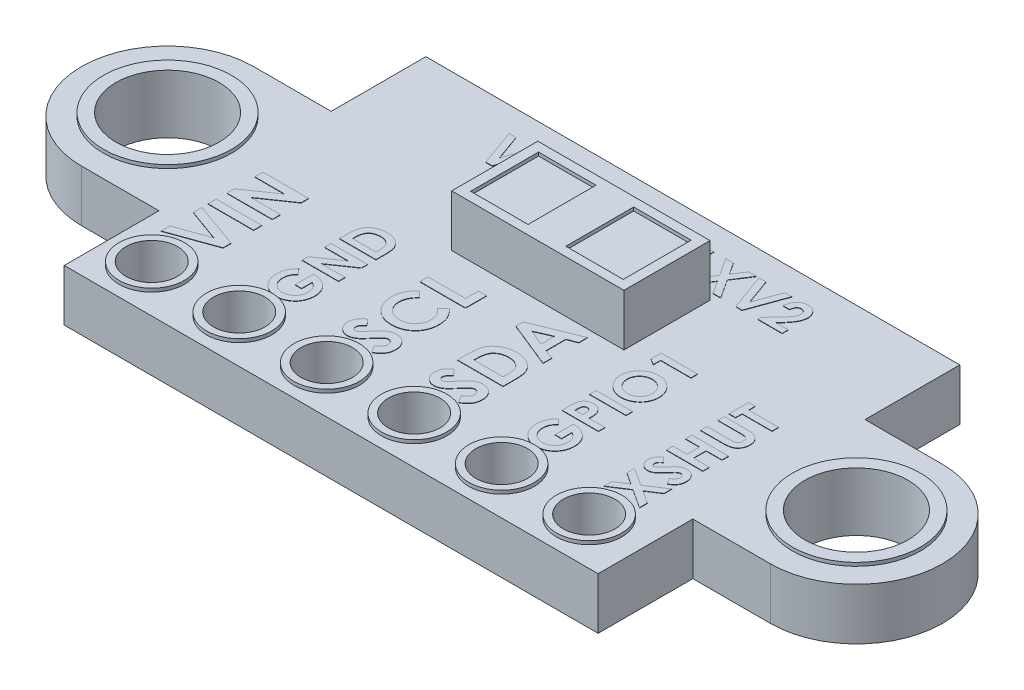
from build123d import *

# Parameters (mm, degrees)
IZIM1_R                          = 1.5
Y_KSEKLIK_EKSTR_ZYON1_DEPTH      = 1.5
IZIM2_W                          = 5
IZIM2_H                          = 2.5
Y_KSEKLIK_EKSTR_ZYON2_DEPTH      = 1.5
IZIM3_W                          = 1.667715664
IZIM3_H                          = 1.971920716
KES_EKSTR_ZYON1_DEPTH            = 0.1
Y_KSEKLIK_EKSTR_ZYON3_DEPTH      = 0.1
Y_KSEKLIK_EKSTR_ZYON3_DEPTH_BACK = 1.6
IZIM4_R                          = 1.860362083
IZIM4_R_2                        = 1.5
IZIM5_R                          = 0.75
KES_EKSTR_ZYON2_DEPTH            = 3.1
Y_KSEKLIK_EKSTR_ZYON4_START      = 0.1
IZIM6_R                          = 0.95
IZIM6_R_2                        = 0.75
Y_KSEKLIK_EKSTR_ZYON4_DEPTH      = 1.7
L_O_ALTMA1_COUNT                 = 6
L_O_ALTMA1_PITCH                 = 2.54
IZIM7_W                          = 1.322916667
IZIM7_H                          = 0.237446581
IZIM7_W_2                        = 1.058333333
IZIM7_H_2                        = 0.189957265
Y_KSEKLIK_EKSTR_ZYON5_DEPTH      = 0.01
Y_KSEKLIK_EKSTR_ZYON6_DEPTH      = 0.01
IZIM9_W                          = 0.486014921
IZIM9_H                          = 1.053032329
IZIM9_W_2                        = 1.296039789
IZIM9_H_2                        = 2.835087037
IZIM9_W_3                        = 0.459463806
IZIM9_H_3                        = 1.194605896
Y_KSEKLIK_EKSTR_ZYON7_DEPTH      = 1
IZIM10_W                         = 0.459463806
IZIM10_H                         = 1.194605896
IZIM10_W_2                       = 0.486014921
IZIM10_H_2                       = 1.053032329
KES_EKSTR_ZYON3_DEPTH            = 0.5


with BuildPart() as part:
    # Çizim1 → Yükseklik-Ekstrüzyon1 (new body)
    with BuildSketch(Plane(origin=(0, 0, 0), x_dir=(1, 0, 0), z_dir=(0, 1, 0))):
        with BuildLine():
            Line((-7.75, -5.25), (7.75, -5.25))
            Line((7.75, -5.25), (7.75, -2.5))
            Line((7.75, -2.5), (10, -2.5))
            ThreePointArc((10, -2.5), (12.5, 0), (10, 2.5))
            Line((10, 2.5), (7.75, 2.5))
            Line((7.75, 2.5), (7.75, 5.25))
            Line((7.75, 5.25), (-7.75, 5.25))
            Line((-7.75, 5.25), (-7.75, 2.5))
            Line((-7.75, 2.5), (-10, 2.5))
            ThreePointArc((-10, 2.5), (-12.5, 0), (-10, -2.5))
            Line((-10, -2.5), (-7.75, -2.5))
            Line((-7.75, -2.5), (-7.75, -5.25))
        make_face()
        with Locations((-10, 0)):
            Circle(IZIM1_R, mode=Mode.SUBTRACT)
        with Locations((10, 0)):
            Circle(IZIM1_R, mode=Mode.SUBTRACT)
    extrude(amount=Y_KSEKLIK_EKSTR_ZYON1_DEPTH)

    # Çizim2 → Yükseklik-Ekstrüzyon2 (add)
    with BuildSketch(Plane(origin=(0, 1.5, 0), x_dir=(1, 0, 0), z_dir=(0, 1, 0))):
        with Locations((0, 2)):
            Rectangle(IZIM2_W, IZIM2_H)
    extrude(amount=Y_KSEKLIK_EKSTR_ZYON2_DEPTH)

    # Çizim3 → Kes-Ekstrüzyon1 (cut)
    with BuildSketch(Plane(origin=(0, 3, 0), x_dir=(1, 0, 0), z_dir=(0, 1, 0))):
        with Locations((-1.381810813, 2)):
            Rectangle(IZIM3_W, IZIM3_H)
        with Locations((1.381810813, 2)):
            Rectangle(IZIM3_W, IZIM3_H)
    extrude(amount=-KES_EKSTR_ZYON1_DEPTH, mode=Mode.SUBTRACT)

    # Çizim4 → Yükseklik-Ekstrüzyon3 (add, two sides: drawn at the far end of the back side and taken through both)
    # profile 1 of 2: a face of its own
    with BuildSketch(Plane(origin=(0, 1.5, 0), x_dir=(1, 0, 0), z_dir=(0, 1, 0)).offset(-Y_KSEKLIK_EKSTR_ZYON3_DEPTH_BACK)):
        with Locations((10, 0)):
            Circle(IZIM4_R)
        with Locations((10, 0)):
            Circle(IZIM4_R_2, mode=Mode.SUBTRACT)
    # profile 2 of 2: a face of its own
    with BuildSketch(Plane(origin=(0, 1.5, 0), x_dir=(1, 0, 0), z_dir=(0, 1, 0)).offset(-Y_KSEKLIK_EKSTR_ZYON3_DEPTH_BACK)):
        with Locations((-10, 0)):
            Circle(IZIM4_R)
        with Locations((-10, 0)):
            Circle(IZIM4_R_2, mode=Mode.SUBTRACT)
    extrude(amount=Y_KSEKLIK_EKSTR_ZYON3_DEPTH + Y_KSEKLIK_EKSTR_ZYON3_DEPTH_BACK)

    # Çizim5 → Kes-Ekstrüzyon2 (cut)
    with BuildSketch(Plane(origin=(0, 1.5, 0), x_dir=(1, 0, 0), z_dir=(0, 1, 0))):
        with Locations((-6.48, -3.98)):
            Circle(IZIM5_R)
        with Locations((-3.94, -3.98)):
            Circle(IZIM5_R)
        with Locations((-1.4, -3.98)):
            Circle(IZIM5_R)
        with Locations((1.14, -3.98)):
            Circle(IZIM5_R)
        with Locations((3.68, -3.98)):
            Circle(IZIM5_R)
        with Locations((6.22, -3.98)):
            Circle(IZIM5_R)
    extrude(amount=-KES_EKSTR_ZYON2_DEPTH, mode=Mode.SUBTRACT)

    # Çizim6 → Yükseklik-Ekstrüzyon4 (add)
    with BuildSketch(Plane(origin=(0, 1.5, 0), x_dir=(1, 0, 0), z_dir=(0, 1, 0)).offset(Y_KSEKLIK_EKSTR_ZYON4_START)):
        with Locations((-6.48, -3.98)):
            Circle(IZIM6_R)
        with Locations((-6.48, -3.98)):
            Circle(IZIM6_R_2, mode=Mode.SUBTRACT)
    y_kseklik_ekstr_zyon4 = extrude(amount=-Y_KSEKLIK_EKSTR_ZYON4_DEPTH)

    # LÇoğaltma1: Yükseklik-Ekstrüzyon4 ×6
    with Locations(*[(i * L_O_ALTMA1_PITCH, 0, 0) for i in range(1, L_O_ALTMA1_COUNT)]):
        add(y_kseklik_ekstr_zyon4)

    # Çizim7 → Yükseklik-Ekstrüzyon5 (add)
    # profile 1 of 22: a face of its own
    with BuildSketch(Plane(origin=(0, 1.5, 0), x_dir=(1, 0, 0), z_dir=(0, 1, 0))):
        Polygon((-7.200769609, -2.987598825), (-7.200769609, -2.733986796), (-6.261053563, -2.393982372), (-7.200769609, -2.053182926), (-7.200769609, -1.800365919), (-5.877852942, -2.280029213), (-5.877852942, -2.508730552), align=None)
    # profile 2 of 22: a face of its own
    with BuildSketch(Plane(origin=(0, 1.5, 0), x_dir=(1, 0, 0), z_dir=(0, 1, 0))):
        with Locations((-6.539311276, -1.503557693)):
            Rectangle(IZIM7_W, IZIM7_H)
    # profile 3 of 22: a face of its own
    with BuildSketch(Plane(origin=(0, 1.5, 0), x_dir=(1, 0, 0), z_dir=(0, 1, 0))):
        Polygon((-7.200769609, -1.07954594), (-7.200769609, -0.865685013), (-6.33022048, -0.265443376), (-7.200769609, -0.265443376), (-7.200769609, -0.027996795), (-5.877852942, -0.027996795), (-5.877852942, -0.243447766), (-6.745751997, -0.842099359), (-5.877852942, -0.842099359), (-5.877852942, -1.07954594), align=None)
    # profile 4 of 22: a face of its own
    with BuildSketch(Plane(origin=(0, 1.5, 0), x_dir=(1, 0, 0), z_dir=(0, 1, 0))):
        with BuildLine():
            Line((-4.252500455, -1.937957732), (-4.114908641, -2.081697716))
            add(Edge.make_bspline(
                [(-4.114908641, -2.081697716), (-4.126302422, -2.093077862), (-4.148658901, -2.115407586), (-4.177757395, -2.151925056), (-4.202496867, -2.189746072), (-4.222839392, -2.228995119), (-4.238618822, -2.26972687), (-4.249906354, -2.311860945), (-4.25660118, -2.355465889), (-4.257538433, -2.38498449), (-4.258012608, -2.399918536)],
                knots=[0, 0, 0, 0, 1.075575784, 2.110457258, 3.113929901, 4.09197124, 5.059417775, 6.02750972, 7.002078037, 8, 8, 8, 8], degree=3))
            add(Edge.make_bspline(
                [(-4.258012608, -2.399918536), (-4.257680356, -2.412865898), (-4.257027949, -2.438289176), (-4.252073621, -2.475646235), (-4.243797639, -2.511343195), (-4.232332645, -2.545548696), (-4.217413075, -2.578053927), (-4.199269148, -2.60904713), (-4.177762237, -2.638337956), (-4.153299374, -2.665694299), (-4.12659287, -2.690606558), (-4.098000238, -2.712341117), (-4.068033068, -2.730942664), (-4.036523681, -2.746017943), (-4.003704006, -2.757776505), (-3.969440665, -2.76599844), (-3.933807105, -2.771268238), (-3.909493644, -2.771887295), (-3.897178607, -2.772200855)],
                knots=[0, 0, 0, 0, 1.07501736, 2.110890821, 3.123068569, 4.114115229, 5.101558292, 6.087971832, 7.091606401, 8.114127012, 9.131531654, 10.119863779, 11.092210096, 12.055570724, 13.015277632, 13.98177939, 14.977748899, 16, 16, 16, 16], degree=3))
            add(Edge.make_bspline(
                [(-3.897178607, -2.772200855), (-3.88443767, -2.771907582), (-3.85933628, -2.771329793), (-3.822498911, -2.765779486), (-3.78705871, -2.75722828), (-3.75327862, -2.7447116), (-3.720695962, -2.729307337), (-3.689941664, -2.709772274), (-3.660546956, -2.68699213), (-3.633020234, -2.661009048), (-3.607657197, -2.63274178), (-3.585742373, -2.602143446), (-3.566952137, -2.570046797), (-3.55160056, -2.536249318), (-3.540003815, -2.500794491), (-3.531431144, -2.463853925), (-3.526268142, -2.425222807), (-3.525639392, -2.398874162), (-3.5253203, -2.385502137)],
                knots=[0, 0, 0, 0, 1.022033888, 2.013546672, 2.983454993, 3.943493592, 4.899972998, 5.871025147, 6.861547676, 7.880838944, 8.905404004, 9.905061033, 10.896427776, 11.886495431, 12.878446209, 13.885654703, 14.926962766, 16, 16, 16, 16], degree=3))
            add(Edge.make_bspline(
                [(-3.5253203, -2.385502137), (-3.525398785, -2.376803629), (-3.525552869, -2.359726523), (-3.528054082, -2.334677319), (-3.531629857, -2.310686198), (-3.536363758, -2.28766025), (-3.543063077, -2.265831973), (-3.550897106, -2.244899142), (-3.560142823, -2.224984404), (-3.571119221, -2.206195734), (-3.583422421, -2.188253503), (-3.597499899, -2.171325653), (-3.613034259, -2.155115251), (-3.630215274, -2.139811712), (-3.649196564, -2.125674053), (-3.669629323, -2.112249341), (-3.691716332, -2.099691284), (-3.707313059, -2.09227106), (-3.715277565, -2.088481904)],
                knots=[0, 0, 0, 0, 1.109579412, 2.178351274, 3.208885622, 4.204702371, 5.174744997, 6.119429583, 7.05542196, 7.97267548, 8.893247984, 9.828544973, 10.778894627, 11.756245826, 12.760884819, 13.796418446, 14.874735809, 16, 16, 16, 16], degree=3))
            Line((-3.715277565, -2.088481904), (-3.715277565, -2.392286325))
            Line((-3.715277565, -2.392286325), (-3.90523483, -2.392286325))
            Line((-3.90523483, -2.392286325), (-3.90523483, -1.864603699))
            Line((-3.90523483, -1.864603699), (-3.860077578, -1.863119658))
            add(Edge.make_bspline(
                [(-3.860077578, -1.863119658), (-3.84848005, -1.863310346), (-3.825305691, -1.863691383), (-3.790803018, -1.867173654), (-3.756757952, -1.872941983), (-3.723204685, -1.880827839), (-3.689978633, -1.890710819), (-3.657397935, -1.903314687), (-3.625241751, -1.918073831), (-3.593646295, -1.934610062), (-3.563330837, -1.953193304), (-3.534621602, -1.973196298), (-3.507589337, -1.994354756), (-3.482570446, -2.017019512), (-3.459592515, -2.04114119), (-3.438366, -2.066428488), (-3.418705611, -2.092890199), (-3.401373912, -2.120995035), (-3.385921462, -2.150270637), (-3.372183384, -2.18071539), (-3.360834863, -2.212507511), (-3.351455259, -2.245504476), (-3.344240219, -2.279721842), (-3.33928726, -2.315145664), (-3.335923204, -2.351799451), (-3.335552015, -2.376660785), (-3.335363035, -2.389318243)],
                knots=[0, 0, 0, 0, 1.006947556, 2.012098127, 3.007912615, 4.003802745, 5.003693661, 6.015789779, 7.034654729, 8.075083123, 9.110776623, 10.12033905, 11.112364132, 12.089932562, 13.049221985, 14.003156825, 14.955669239, 15.909347409, 16.867458246, 17.828943829, 18.807340259, 19.796171017, 20.806031855, 21.841452577, 22.901035528, 24, 24, 24, 24], degree=3))
            add(Edge.make_bspline(
                [(-3.335363035, -2.389318243), (-3.335551922, -2.402822394), (-3.335926353, -2.42959165), (-3.339357122, -2.469182532), (-3.345194821, -2.50757604), (-3.35266326, -2.544975992), (-3.362946042, -2.58111052), (-3.375199138, -2.616288296), (-3.389933989, -2.650223753), (-3.406583777, -2.683084721), (-3.425477458, -2.714438375), (-3.44627076, -2.744217869), (-3.469100887, -2.772259752), (-3.493584746, -2.798851505), (-3.520324402, -2.823371762), (-3.54845301, -2.84673438), (-3.579002303, -2.867807267), (-3.610981593, -2.887497457), (-3.64437849, -2.904987609), (-3.678571569, -2.920293192), (-3.713313091, -2.93328462), (-3.748839807, -2.943691414), (-3.784942394, -2.95193552), (-3.821749913, -2.957953372), (-3.859166396, -2.961320047), (-3.884310596, -2.961877522), (-3.896966601, -2.96215812)],
                knots=[0, 0, 0, 0, 1.08412885, 2.149066736, 3.187446822, 4.201211187, 5.20898726, 6.20137506, 7.190057482, 8.177191892, 9.15710824, 10.126769281, 11.090919562, 12.058536462, 13.026153363, 14.001871638, 14.991985849, 16.003078977, 17.015762975, 18.016485971, 19.009327865, 19.991410284, 20.986600416, 21.980997625, 22.983761488, 24, 24, 24, 24], degree=3))
            add(Edge.make_bspline(
                [(-3.896966601, -2.96215812), (-3.914232562, -2.961783885), (-3.948327717, -2.961044883), (-3.99854523, -2.954174474), (-4.047078898, -2.943539537), (-4.0937944, -2.928049279), (-4.13888007, -2.908521306), (-4.182296235, -2.884691535), (-4.223987146, -2.856362443), (-4.249796116, -2.834423614), (-4.262888743, -2.823294271)],
                knots=[0, 0, 0, 0, 1.034063014, 2.041967874, 3.031271063, 4.007437694, 4.986016733, 5.971461028, 6.970942901, 8, 8, 8, 8], degree=3))
            add(Edge.make_bspline(
                [(-4.262888743, -2.823294271), (-4.27046341, -2.816384651), (-4.285499011, -2.802669161), (-4.306391284, -2.780744974), (-4.326030793, -2.758264784), (-4.344001096, -2.734917236), (-4.36069557, -2.710825065), (-4.375801264, -2.685918927), (-4.389799153, -2.660329476), (-4.401974449, -2.633857145), (-4.412890619, -2.60664052), (-4.422127233, -2.578559062), (-4.430308677, -2.549823096), (-4.436532658, -2.520178165), (-4.441715515, -2.489923752), (-4.445189336, -2.458845102), (-4.4477354, -2.427026906), (-4.447891097, -2.405506679), (-4.447969873, -2.394618389)],
                knots=[0, 0, 0, 0, 1.020590567, 2.025856924, 3.013483481, 3.991664875, 4.957826714, 5.930500614, 6.890802512, 7.860442893, 8.829981142, 9.809047939, 10.802672283, 11.803273349, 12.823572789, 13.857849586, 14.916166035, 16, 16, 16, 16], degree=3))
            add(Edge.make_bspline(
                [(-4.447969873, -2.394618389), (-4.447794346, -2.383236592), (-4.447445112, -2.360590995), (-4.44502864, -2.326920741), (-4.441300594, -2.293718359), (-4.435708311, -2.261123765), (-4.428811863, -2.229027572), (-4.419975805, -2.197595919), (-4.409936453, -2.166623751), (-4.401932339, -2.146460987), (-4.397936486, -2.136395232)],
                knots=[0, 0, 0, 0, 1.03180557, 2.052914215, 3.058998889, 4.059601663, 5.049854447, 6.033765722, 7.018406786, 8, 8, 8, 8], degree=3))
            add(Edge.make_bspline(
                [(-4.397936486, -2.136395232), (-4.394244835, -2.127925265), (-4.38673612, -2.110697584), (-4.37297446, -2.085649923), (-4.357795921, -2.060437682), (-4.340207604, -2.035744336), (-4.321207695, -2.010854865), (-4.300136772, -1.986277126), (-4.277188756, -1.961826702), (-4.260836466, -1.946017096), (-4.252500455, -1.937957732)],
                knots=[0, 0, 0, 0, 0.894422958, 1.819231551, 2.765348375, 3.743239639, 4.753552307, 5.797344382, 6.877138289, 8, 8, 8, 8], degree=3))
        make_face()
    # profile 5 of 22: a face of its own
    with BuildSketch(Plane(origin=(0, 1.5, 0), x_dir=(1, 0, 0), z_dir=(0, 1, 0))):
        Polygon((-4.420833121, -1.673162393), (-4.420833121, -1.502073651), (-3.724393818, -1.021880342), (-4.420833121, -1.021880342), (-4.420833121, -0.831923077), (-3.362499787, -0.831923077), (-3.362499787, -1.004283854), (-4.056819031, -1.483205128), (-3.362499787, -1.483205128), (-3.362499787, -1.673162393), align=None)
    # profile 6 of 22: a face of its own
    with BuildSketch(Plane(origin=(0, 1.5, 0), x_dir=(1, 0, 0), z_dir=(0, 1, 0))):
        with BuildLine():
            Line((-4.420833121, -0.587692308), (-4.420833121, -0.348337674))
            add(Edge.make_bspline(
                [(-4.420833121, -0.348337674), (-4.420705695, -0.329676769), (-4.420459381, -0.293605031), (-4.417577676, -0.241351653), (-4.413346484, -0.192726155), (-4.406869258, -0.147839298), (-4.399356272, -0.106526895), (-4.389278091, -0.069102317), (-4.377786347, -0.035294192), (-4.364228822, -0.004774172), (-4.348430476, 0.02308893), (-4.330830336, 0.049545505), (-4.310786056, 0.07454404), (-4.288683693, 0.098435235), (-4.264119066, 0.120910799), (-4.237499006, 0.142345023), (-4.208437498, 0.162213102), (-4.177631344, 0.181115605), (-4.144949989, 0.198210403), (-4.110671611, 0.213121125), (-4.075016804, 0.225611927), (-4.037947569, 0.23576135), (-3.999586965, 0.243851612), (-3.959857583, 0.249512205), (-3.918796207, 0.253011641), (-3.890966896, 0.253366629), (-3.876826043, 0.253547009)],
                knots=[0, 0, 0, 0, 1.443572968, 2.79044287, 4.047742841, 5.218390556, 6.298195001, 7.294187071, 8.214052338, 9.058415274, 9.873579163, 10.689402867, 11.514245497, 12.34988967, 13.204999844, 14.087904451, 14.991805053, 15.926675376, 16.882870032, 17.842731001, 18.816259901, 19.80313118, 20.814314197, 21.847329874, 22.906167961, 24, 24, 24, 24], degree=3))
            add(Edge.make_bspline(
                [(-3.876826043, 0.253547009), (-3.856872378, 0.253074677), (-3.817592423, 0.252144866), (-3.75994954, 0.244312654), (-3.704693088, 0.231645315), (-3.652255303, 0.213833886), (-3.603103153, 0.191752482), (-3.558103413, 0.165373773), (-3.517497627, 0.13508453), (-3.481487947, 0.10123763), (-3.450537224, 0.06458967), (-3.424029897, 0.026505082), (-3.403127704, -0.013387292), (-3.389869395, -0.0485377), (-3.38163143, -0.07901833), (-3.376736908, -0.105777176), (-3.37236931, -0.136193057), (-3.368468237, -0.170467655), (-3.365868297, -0.208597599), (-3.364047683, -0.250589342), (-3.362701883, -0.296387787), (-3.362568917, -0.328196049), (-3.362499787, -0.344733574)],
                knots=[0, 0, 0, 0, 1.315448733, 2.589537832, 3.828572084, 5.048874227, 6.235690825, 7.376293813, 8.481764604, 9.569767924, 10.627792487, 11.639989165, 12.623927547, 13.589954798, 14.111118089, 14.704320463, 15.382530461, 16.137544902, 16.978618851, 17.902349489, 18.90940453, 20, 20, 20, 20], degree=3))
            Line((-3.362499787, -0.344733574), (-3.362499787, -0.587692308))
            Line((-3.362499787, -0.587692308), (-4.420833121, -0.587692308))
        make_face()
        with BuildLine():
            Line((-4.230875856, -0.397735043), (-3.552457052, -0.397735043))
            Line((-3.552457052, -0.397735043), (-3.552457052, -0.298516293))
            add(Edge.make_bspline(
                [(-3.552457052, -0.298516293), (-3.552514209, -0.286712832), (-3.552624125, -0.264014285), (-3.554134352, -0.231202684), (-3.556586782, -0.200922038), (-3.560214295, -0.173132685), (-3.564579122, -0.147770739), (-3.569977837, -0.124928713), (-3.576543086, -0.104561586), (-3.584280299, -0.086501401), (-3.593114043, -0.070012852), (-3.603429133, -0.054737545), (-3.614892469, -0.039995012), (-3.627830819, -0.026057724), (-3.642075683, -0.0128738), (-3.657699674, -0.000521005), (-3.67465534, 0.011165471), (-3.693032269, 0.021885679), (-3.712636413, 0.03168186), (-3.733277872, 0.040372171), (-3.755128548, 0.047577722), (-3.777983891, 0.053566534), (-3.802042883, 0.057846219), (-3.827127323, 0.061386843), (-3.853336592, 0.063212137), (-3.871170254, 0.063462648), (-3.880218137, 0.063589744)],
                knots=[0, 0, 0, 0, 1.502695833, 2.889746668, 4.180916226, 5.369476429, 6.456726991, 7.456222963, 8.355346258, 9.177624335, 9.954596642, 10.733182277, 11.52153258, 12.330160087, 13.151502329, 13.990398686, 14.863901178, 15.771270193, 16.696748626, 17.652564526, 18.61995629, 19.623816541, 20.657945923, 21.72937045, 22.847999446, 24, 24, 24, 24], degree=3))
            add(Edge.make_bspline(
                [(-3.880218137, 0.063589744), (-3.894083476, 0.063337519), (-3.921119813, 0.062845701), (-3.960493571, 0.058073067), (-3.997523456, 0.05038296), (-4.032114342, 0.0391806), (-4.064486138, 0.025404627), (-4.094221693, 0.007888189), (-4.121808406, -0.012304589), (-4.137988689, -0.028281718), (-4.146073505, -0.036265024)],
                knots=[0, 0, 0, 0, 1.138242922, 2.219485503, 3.251901297, 4.239342788, 5.201071, 6.134757343, 7.067992642, 8, 8, 8, 8], degree=3))
            add(Edge.make_bspline(
                [(-4.146073505, -0.036265024), (-4.152963095, -0.044136664), (-4.167034302, -0.060213596), (-4.183895207, -0.088439407), (-4.198709164, -0.119542789), (-4.21045498, -0.154235293), (-4.219744072, -0.192181633), (-4.226150532, -0.233607817), (-4.230267255, -0.278292), (-4.230668643, -0.30924816), (-4.230875856, -0.325229033)],
                knots=[0, 0, 0, 0, 0.813307809, 1.661089106, 2.549956539, 3.493439533, 4.508053171, 5.589449661, 6.755572447, 8, 8, 8, 8], degree=3))
            Line((-4.230875856, -0.325229033), (-4.230875856, -0.397735043))
        make_face(mode=Mode.SUBTRACT)
    # profile 7 of 22: a face of its own
    with BuildSketch(Plane(origin=(0, 1.5, 0), x_dir=(1, 0, 0), z_dir=(0, 1, 0))):
        with BuildLine():
            Line((-1.9933034, -2.198936966), (-1.830853897, -2.376491887))
            add(Edge.make_bspline(
                [(-1.830853897, -2.376491887), (-1.841582516, -2.384097579), (-1.862179967, -2.398699446), (-1.88976044, -2.422367549), (-1.913288636, -2.445928779), (-1.932666265, -2.469601415), (-1.947775594, -2.493595284), (-1.958473165, -2.517868735), (-1.965273713, -2.542284155), (-1.966120545, -2.558687549), (-1.966537658, -2.566767161)],
                knots=[0, 0, 0, 0, 1.299362458, 2.494594718, 3.587462134, 4.587049575, 5.512617175, 6.380583204, 7.202344345, 8, 8, 8, 8], degree=3))
            add(Edge.make_bspline(
                [(-1.966537658, -2.566767161), (-1.966281214, -2.574307311), (-1.965786089, -2.58886536), (-1.960616923, -2.609522271), (-1.952263829, -2.628085995), (-1.940725363, -2.644062045), (-1.926945086, -2.656914429), (-1.912275308, -2.666907926), (-1.89628042, -2.672715166), (-1.885310846, -2.673460931), (-1.879880256, -2.673830128)],
                knots=[0, 0, 0, 0, 1.184157716, 2.286297433, 3.324836695, 4.370048774, 5.362957217, 6.276446515, 7.146738784, 8, 8, 8, 8], degree=3))
            add(Edge.make_bspline(
                [(-1.879880256, -2.673830128), (-1.874373904, -2.673596427), (-1.863284875, -2.673125784), (-1.847032523, -2.668580018), (-1.831152082, -2.66172825), (-1.821484903, -2.655181107), (-1.816543501, -2.651834519)],
                knots=[0, 0, 0, 0, 0.967525499, 1.948461899, 2.951351359, 4, 4, 4, 4], degree=3))
            add(Edge.make_bspline(
                [(-1.816543501, -2.651834519), (-1.812713563, -2.648780286), (-1.803846612, -2.641709223), (-1.789591085, -2.628623511), (-1.772741382, -2.611536694), (-1.752947401, -2.590873398), (-1.730021211, -2.566705705), (-1.704345775, -2.538658933), (-1.676170808, -2.506528162), (-1.656307599, -2.483991838), (-1.64587877, -2.472159539)],
                knots=[0, 0, 0, 0, 0.473854981, 1.097054127, 1.870604305, 2.795416232, 3.865517794, 5.093525133, 6.47400653, 8, 8, 8, 8], degree=3))
            add(Edge.make_bspline(
                [(-1.64587877, -2.472159539), (-1.636250615, -2.461028816), (-1.617978377, -2.439905016), (-1.592001221, -2.409888136), (-1.568735099, -2.383336541), (-1.548005789, -2.360491708), (-1.530666949, -2.340670979), (-1.515651871, -2.324750979), (-1.503617399, -2.312050366), (-1.496340241, -2.304837905), (-1.49323454, -2.301759816)],
                knots=[0, 0, 0, 0, 1.543627419, 2.929484142, 4.163674036, 5.24627963, 6.164986907, 6.925413438, 7.541394495, 8, 8, 8, 8], degree=3))
            add(Edge.make_bspline(
                [(-1.49323454, -2.301759816), (-1.480594438, -2.290081648), (-1.456295724, -2.267632109), (-1.418649892, -2.238437748), (-1.381932309, -2.214515529), (-1.345542921, -2.19579305), (-1.308641533, -2.181783103), (-1.270432313, -2.171967944), (-1.230625149, -2.166000215), (-1.203513813, -2.165346612), (-1.18980113, -2.165016026)],
                knots=[0, 0, 0, 0, 1.206593015, 2.319495511, 3.336910718, 4.276265636, 5.184178927, 6.099356736, 7.038670786, 8, 8, 8, 8], degree=3))
            add(Edge.make_bspline(
                [(-1.18980113, -2.165016026), (-1.176440268, -2.16525283), (-1.15022576, -2.165717448), (-1.111864732, -2.171408132), (-1.075151567, -2.179522714), (-1.040485737, -2.192069275), (-1.007298287, -2.207360975), (-0.976105893, -2.226531234), (-0.946593938, -2.249044427), (-0.919285931, -2.274846657), (-0.894517727, -2.303392025), (-0.872424542, -2.333991119), (-0.854328728, -2.367060358), (-0.838831208, -2.401941107), (-0.827802885, -2.439270191), (-0.819126559, -2.478367265), (-0.814043434, -2.519638702), (-0.8135022, -2.54784955), (-0.813225692, -2.562262036)],
                knots=[0, 0, 0, 0, 1.043169307, 2.046737005, 3.02462096, 3.976528701, 4.921503154, 5.875710796, 6.831116189, 7.817539083, 8.805892356, 9.780872653, 10.7604363, 11.74661763, 12.757588865, 13.796088471, 14.874055702, 16, 16, 16, 16], degree=3))
            add(Edge.make_bspline(
                [(-0.813225692, -2.562262036), (-0.813426268, -2.573576534), (-0.813823523, -2.59598573), (-0.817071374, -2.629012424), (-0.82230166, -2.660907538), (-0.829838033, -2.691616057), (-0.839256865, -2.721378238), (-0.851280887, -2.749903963), (-0.865103664, -2.777398236), (-0.881022209, -2.803804538), (-0.899520821, -2.828956353), (-0.919875345, -2.85355855), (-0.94307185, -2.876800738), (-0.968659977, -2.899203791), (-0.99679666, -2.920478613), (-1.027054944, -2.94135156), (-1.060006403, -2.960886582), (-1.083121713, -2.972954543), (-1.0949285, -2.97911859)],
                knots=[0, 0, 0, 0, 1.016956594, 2.014157282, 2.980233409, 3.920138626, 4.854357287, 5.783465618, 6.699725051, 7.61900777, 8.551402113, 9.504102091, 10.486778735, 11.499758944, 12.559144124, 13.656050795, 14.802762778, 16, 16, 16, 16], degree=3))
            Line((-1.0949285, -2.97911859), (-1.220276974, -2.770292802))
            add(Edge.make_bspline(
                [(-1.220276974, -2.770292802), (-1.206874689, -2.762582537), (-1.181181364, -2.747801301), (-1.146659124, -2.722753114), (-1.11709654, -2.697092525), (-1.093016133, -2.670226284), (-1.074095916, -2.642481075), (-1.060574217, -2.613722883), (-1.0522043, -2.583931501), (-1.05118214, -2.563638965), (-1.050672273, -2.553516794)],
                knots=[0, 0, 0, 0, 1.283663364, 2.460892379, 3.537111102, 4.529833553, 5.449777664, 6.316464042, 7.160231139, 8, 8, 8, 8], degree=3))
            add(Edge.make_bspline(
                [(-1.050672273, -2.553516794), (-1.051088658, -2.543221096), (-1.051896504, -2.523245943), (-1.059358339, -2.494733969), (-1.071073967, -2.468593111), (-1.087790553, -2.445997146), (-1.107084033, -2.426864308), (-1.128548913, -2.412743176), (-1.151773394, -2.403872185), (-1.167906646, -2.402934306), (-1.176020748, -2.402462607)],
                knots=[0, 0, 0, 0, 1.13588714, 2.203786484, 3.234766741, 4.283437687, 5.291419208, 6.222934724, 7.106237994, 8, 8, 8, 8], degree=3))
            add(Edge.make_bspline(
                [(-1.176020748, -2.402462607), (-1.183569599, -2.402898202), (-1.198904367, -2.403783071), (-1.221704701, -2.410300748), (-1.244494666, -2.420489864), (-1.263187612, -2.432544306), (-1.27883871, -2.444811211), (-1.292399677, -2.456541139), (-1.307382172, -2.470825088), (-1.323805042, -2.487626841), (-1.34181286, -2.506724402), (-1.361403864, -2.528133859), (-1.382405481, -2.552100372), (-1.396711574, -2.569039951), (-1.404192072, -2.577897469)],
                knots=[0, 0, 0, 0, 0.916159276, 1.861089862, 2.860218735, 3.940849679, 4.552606315, 5.27541173, 6.11797699, 7.06649574, 8.129236253, 9.306560635, 10.591630461, 12, 12, 12, 12], degree=3))
            add(Edge.make_bspline(
                [(-1.404192072, -2.577897469), (-1.418439042, -2.594735977), (-1.445783291, -2.627054171), (-1.486170046, -2.672723655), (-1.523914606, -2.713876737), (-1.559486018, -2.750154542), (-1.592219559, -2.782030382), (-1.622405824, -2.809253575), (-1.650257415, -2.831678225), (-1.6834669, -2.854954859), (-1.723575106, -2.877338921), (-1.771799364, -2.896721425), (-1.820066053, -2.909178249), (-1.8525142, -2.910584542), (-1.86848494, -2.911276709)],
                knots=[0, 0, 0, 0, 1.345561566, 2.582539916, 3.71901348, 4.751744315, 5.681651107, 6.506005906, 7.230637833, 7.861516384, 8.978504332, 10.023243174, 11.027054763, 12, 12, 12, 12], degree=3))
            add(Edge.make_bspline(
                [(-1.86848494, -2.911276709), (-1.879811038, -2.910989746), (-1.902124667, -2.910424399), (-1.934933695, -2.905381585), (-1.96659131, -2.897844494), (-1.996983619, -2.886899991), (-2.026066556, -2.872689854), (-2.05400529, -2.855452781), (-2.080506529, -2.834785195), (-2.105830955, -2.811790278), (-2.128736704, -2.786149457), (-2.148942914, -2.758863546), (-2.166101491, -2.730052215), (-2.179875187, -2.699604458), (-2.190808778, -2.667768966), (-2.198468196, -2.634465309), (-2.203047696, -2.599756054), (-2.203668169, -2.576144747), (-2.203984239, -2.564117087)],
                knots=[0, 0, 0, 0, 1.010608097, 1.99100651, 2.956992389, 3.912457524, 4.868345712, 5.842283282, 6.837666818, 7.864758285, 8.892394644, 9.901925088, 10.892014243, 11.880216914, 12.880338321, 13.892361018, 14.926363314, 16, 16, 16, 16], degree=3))
            add(Edge.make_bspline(
                [(-2.203984239, -2.564117087), (-2.20341405, -2.548530137), (-2.202278172, -2.517479275), (-2.193395549, -2.4715699), (-2.179427832, -2.426726655), (-2.162573737, -2.390593962), (-2.146255323, -2.361837147), (-2.131207133, -2.33981808), (-2.114034266, -2.317281537), (-2.094252713, -2.294576355), (-2.07251132, -2.271151371), (-2.04830893, -2.247352664), (-2.021894522, -2.222926724), (-2.003000731, -2.20707364), (-1.9933034, -2.198936966)],
                knots=[0, 0, 0, 0, 1.282949271, 2.555771389, 3.837399776, 5.142782039, 5.830402679, 6.558840402, 7.337330299, 8.162747002, 9.037840561, 9.968992266, 10.957575255, 12, 12, 12, 12], degree=3))
        make_face()
    # profile 8 of 22: a face of its own
    with BuildSketch(Plane(origin=(0, 1.5, 0), x_dir=(1, 0, 0), z_dir=(0, 1, 0))):
        with BuildLine():
            Line((-1.940566938, -0.740336538), (-1.774142325, -0.914446364))
            add(Edge.make_bspline(
                [(-1.774142325, -0.914446364), (-1.78941657, -0.929214402), (-1.819251956, -0.958061008), (-1.858707677, -1.004567234), (-1.891726856, -1.052808456), (-1.918977513, -1.102303297), (-1.940426119, -1.153148626), (-1.955592637, -1.205514966), (-1.964942153, -1.2593258), (-1.966003719, -1.295754688), (-1.966537658, -1.314077441)],
                knots=[0, 0, 0, 0, 1.115315123, 2.178559852, 3.196385012, 4.180486591, 5.141138664, 6.08807191, 7.038351522, 8, 8, 8, 8], degree=3))
            add(Edge.make_bspline(
                [(-1.966537658, -1.314077441), (-1.966114581, -1.329378586), (-1.965279684, -1.359573712), (-1.959144318, -1.403903879), (-1.948750215, -1.446324053), (-1.934302488, -1.486867888), (-1.916107955, -1.525735838), (-1.893238739, -1.562565973), (-1.866458127, -1.597556222), (-1.835812983, -1.630297753), (-1.802083157, -1.659856274), (-1.766559605, -1.68648892), (-1.728613999, -1.708548556), (-1.688799704, -1.726555812), (-1.647102343, -1.740745944), (-1.603524001, -1.75081725), (-1.557966289, -1.756652572), (-1.526995371, -1.75752258), (-1.511255039, -1.757964744)],
                knots=[0, 0, 0, 0, 1.035268443, 2.04298821, 3.02163646, 3.985902049, 4.951223231, 5.920091634, 6.913651787, 7.92868536, 8.949353712, 9.945284791, 10.92850487, 11.913014323, 12.897904816, 13.904240668, 14.934873455, 16, 16, 16, 16], degree=3))
            add(Edge.make_bspline(
                [(-1.511255039, -1.757964744), (-1.500207753, -1.757835335), (-1.478433326, -1.757580269), (-1.446304696, -1.754864311), (-1.41506865, -1.750341336), (-1.38480026, -1.744040802), (-1.355460004, -1.735964039), (-1.326979178, -1.726633987), (-1.29969736, -1.714717128), (-1.273103732, -1.70160874), (-1.247838457, -1.686527951), (-1.223884902, -1.670014441), (-1.201237705, -1.652220398), (-1.179977392, -1.632908182), (-1.160410018, -1.611834608), (-1.142002792, -1.589508635), (-1.125046069, -1.565708474), (-1.109809871, -1.540424584), (-1.095608119, -1.514422084), (-1.083847702, -1.487165291), (-1.073275656, -1.459416629), (-1.065322327, -1.430689086), (-1.058404603, -1.401488754), (-1.054179736, -1.371409174), (-1.050969395, -1.340735817), (-1.05077174, -1.320004864), (-1.050672273, -1.309572316)],
                knots=[0, 0, 0, 0, 1.103738238, 2.175490744, 3.219137561, 4.256155604, 5.262629953, 6.259184223, 7.247888397, 8.234817694, 9.220364322, 10.185094651, 11.140491148, 12.096499151, 13.05201798, 14.011605636, 14.986460005, 15.968997565, 16.960259839, 17.944382265, 18.933125845, 19.924977513, 20.920749559, 21.929466621, 22.958034467, 24, 24, 24, 24], degree=3))
            add(Edge.make_bspline(
                [(-1.050672273, -1.309572316), (-1.051182182, -1.291876341), (-1.052184021, -1.257108353), (-1.060075461, -1.2060935), (-1.072918257, -1.157403054), (-1.088522378, -1.118640166), (-1.103652786, -1.088253083), (-1.117254347, -1.064925832), (-1.13293478, -1.041059551), (-1.150759199, -1.016690586), (-1.170649718, -0.991677496), (-1.192994991, -0.966434214), (-1.217072755, -0.940322595), (-1.234256951, -0.923216815), (-1.243067606, -0.914446364)],
                knots=[0, 0, 0, 0, 1.404693586, 2.759857621, 4.088769373, 5.395275838, 6.0697462, 6.783214465, 7.53810233, 8.336454657, 9.18000028, 10.074808326, 11.012918585, 12, 12, 12, 12], degree=3))
            Line((-1.243067606, -0.914446364), (-1.065777692, -0.745636685))
            add(Edge.make_bspline(
                [(-1.065777692, -0.745636685), (-1.054321044, -0.757503097), (-1.031960117, -0.780663795), (-1.000209688, -0.815601065), (-0.971678397, -0.850494366), (-0.945330685, -0.884500746), (-0.921934123, -0.918177268), (-0.901465347, -0.951520358), (-0.88340667, -0.98415256), (-0.868062644, -1.016751491), (-0.855033972, -1.049519998), (-0.84381714, -1.083234941), (-0.834328104, -1.117999389), (-0.826671699, -1.154025669), (-0.820532295, -1.190977748), (-0.816388233, -1.22920145), (-0.813602318, -1.268454416), (-0.81335198, -1.295080312), (-0.813225692, -1.308512286)],
                knots=[0, 0, 0, 0, 1.244526981, 2.429050516, 3.560637417, 4.644440555, 5.67424972, 6.652764056, 7.595344123, 8.486817594, 9.369275933, 10.254498637, 11.166417451, 12.086725134, 13.032340136, 13.991389299, 14.986715468, 16, 16, 16, 16], degree=3))
            add(Edge.make_bspline(
                [(-0.813225692, -1.308512286), (-0.813854653, -1.33318516), (-0.815085354, -1.381463115), (-0.824204018, -1.4522132), (-0.839491297, -1.519423881), (-0.861111727, -1.58325867), (-0.888730812, -1.643697269), (-0.922590514, -1.700724215), (-0.962600872, -1.754247594), (-1.008292927, -1.803835042), (-1.058755965, -1.848689249), (-1.112939425, -1.888335174), (-1.171109597, -1.921130284), (-1.232407122, -1.948360771), (-1.297111725, -1.969654653), (-1.365293397, -1.984641937), (-1.436886303, -1.993884485), (-1.485785908, -1.994895633), (-1.510725024, -1.995411325)],
                knots=[0, 0, 0, 0, 1.078019885, 2.10938526, 3.111377082, 4.085535484, 5.04941344, 6.010039228, 6.978205633, 7.964457913, 8.951525778, 9.924444315, 10.892603023, 11.863865945, 12.85144698, 13.863884204, 14.910567087, 16, 16, 16, 16], degree=3))
            add(Edge.make_bspline(
                [(-1.510725024, -1.995411325), (-1.526990494, -1.995195566), (-1.559224678, -1.994767986), (-1.606788533, -1.990189815), (-1.653096685, -1.983971449), (-1.697753416, -1.973756522), (-1.741267036, -1.961881217), (-1.783252475, -1.946581649), (-1.823886591, -1.928806581), (-1.863118064, -1.908510753), (-1.900523247, -1.885264935), (-1.936340684, -1.859956418), (-1.970106399, -1.831971403), (-2.001959604, -1.801593135), (-2.032261091, -1.769102334), (-2.060265645, -1.733942552), (-2.086724564, -1.696713427), (-2.110848738, -1.657157065), (-2.132789259, -1.616174836), (-2.151665274, -1.573965878), (-2.167861586, -1.531074329), (-2.18119607, -1.487370138), (-2.1911765, -1.442776024), (-2.198724019, -1.397590798), (-2.202944724, -1.351435218), (-2.203635527, -1.320445557), (-2.203984239, -1.304802183)],
                knots=[0, 0, 0, 0, 1.071814294, 2.12407397, 3.147667899, 4.14936388, 5.141177959, 6.119239245, 7.091825145, 8.063277363, 9.028022524, 9.992609517, 10.952139039, 11.915934802, 12.892469547, 13.878248468, 14.87668965, 15.901326483, 16.93027266, 17.938917451, 18.9468897, 19.950817235, 20.948103127, 21.957084021, 22.968749718, 24, 24, 24, 24], degree=3))
            add(Edge.make_bspline(
                [(-2.203984239, -1.304802183), (-2.203784141, -1.291456857), (-2.203386026, -1.264904959), (-2.200073166, -1.225363638), (-2.194855581, -1.186142878), (-2.187038366, -1.147362447), (-2.17757136, -1.108847952), (-2.165910563, -1.070760643), (-2.151687124, -1.033205547), (-2.135952999, -0.995857091), (-2.118040514, -0.959460134), (-2.097990998, -0.924330991), (-2.076328964, -0.890382617), (-2.052681822, -0.857819665), (-2.027396918, -0.82641278), (-2.000475089, -0.796195473), (-1.971427979, -0.767457701), (-1.950905957, -0.749422629), (-1.940566938, -0.740336538)],
                knots=[0, 0, 0, 0, 0.996333415, 1.982307736, 2.96084097, 3.949129141, 4.93457382, 5.921430247, 6.92116383, 7.931890485, 8.946633814, 9.948019707, 10.950686436, 11.952094051, 12.951305284, 13.960287133, 14.972390273, 16, 16, 16, 16], degree=3))
        make_face()
    # profile 9 of 22: a face of its own
    with BuildSketch(Plane(origin=(0, 1.5, 0), x_dir=(1, 0, 0), z_dir=(0, 1, 0))):
        Polygon((-2.170063299, -0.502889957), (-2.170063299, -0.265443376), (-1.084593214, -0.265443376), (-1.084593214, 0.107686966), (-0.847146632, 0.107686966), (-0.847146632, -0.502889957), align=None)
    # profile 10 of 22: a face of its own
    with BuildSketch(Plane(origin=(0, 1.5, 0), x_dir=(1, 0, 0), z_dir=(0, 1, 0))):
        with BuildLine():
            Line((0.522049755, -2.198936966), (0.684499258, -2.376491887))
            add(Edge.make_bspline(
                [(0.684499258, -2.376491887), (0.673770639, -2.384097579), (0.653173188, -2.398699446), (0.625592715, -2.422367549), (0.602064519, -2.445928779), (0.58268689, -2.469601415), (0.567577561, -2.493595284), (0.55687999, -2.517868735), (0.550079442, -2.542284155), (0.54923261, -2.558687549), (0.548815497, -2.566767161)],
                knots=[0, 0, 0, 0, 1.299362458, 2.494594718, 3.587462134, 4.587049575, 5.512617175, 6.380583204, 7.202344345, 8, 8, 8, 8], degree=3))
            add(Edge.make_bspline(
                [(0.548815497, -2.566767161), (0.549071941, -2.574307311), (0.549567066, -2.58886536), (0.554736232, -2.609522271), (0.563089326, -2.628085995), (0.574627792, -2.644062045), (0.588408069, -2.656914429), (0.603077847, -2.666907926), (0.619072735, -2.672715166), (0.630042309, -2.673460931), (0.635472899, -2.673830128)],
                knots=[0, 0, 0, 0, 1.184157716, 2.286297433, 3.324836695, 4.370048774, 5.362957217, 6.276446515, 7.146738784, 8, 8, 8, 8], degree=3))
            add(Edge.make_bspline(
                [(0.635472899, -2.673830128), (0.640979251, -2.673596427), (0.65206828, -2.673125784), (0.668320632, -2.668580018), (0.684201072, -2.66172825), (0.693868252, -2.655181107), (0.698809654, -2.651834519)],
                knots=[0, 0, 0, 0, 0.967525499, 1.948461899, 2.951351359, 4, 4, 4, 4], degree=3))
            add(Edge.make_bspline(
                [(0.698809654, -2.651834519), (0.702639592, -2.648780286), (0.711506543, -2.641709223), (0.725762069, -2.628623511), (0.742611773, -2.611536694), (0.762405754, -2.590873398), (0.785331944, -2.566705705), (0.81100738, -2.538658933), (0.839182347, -2.506528162), (0.859045556, -2.483991838), (0.869474384, -2.472159539)],
                knots=[0, 0, 0, 0, 0.473854981, 1.097054127, 1.870604305, 2.795416232, 3.865517794, 5.093525133, 6.47400653, 8, 8, 8, 8], degree=3))
            add(Edge.make_bspline(
                [(0.869474384, -2.472159539), (0.879102539, -2.461028816), (0.897374777, -2.439905016), (0.923351934, -2.409888136), (0.946618056, -2.383336541), (0.967347366, -2.360491708), (0.984686206, -2.340670979), (0.999701284, -2.324750979), (1.011735756, -2.312050366), (1.019012914, -2.304837905), (1.022118615, -2.301759816)],
                knots=[0, 0, 0, 0, 1.543627419, 2.929484142, 4.163674036, 5.24627963, 6.164986907, 6.925413438, 7.541394495, 8, 8, 8, 8], degree=3))
            add(Edge.make_bspline(
                [(1.022118615, -2.301759816), (1.034758717, -2.290081648), (1.059057431, -2.267632109), (1.096703263, -2.238437748), (1.133420846, -2.214515529), (1.169810234, -2.19579305), (1.206711622, -2.181783103), (1.244920842, -2.171967944), (1.284728006, -2.166000215), (1.311839342, -2.165346612), (1.325552025, -2.165016026)],
                knots=[0, 0, 0, 0, 1.206593015, 2.319495511, 3.336910718, 4.276265636, 5.184178927, 6.099356736, 7.038670786, 8, 8, 8, 8], degree=3))
            add(Edge.make_bspline(
                [(1.325552025, -2.165016026), (1.338912887, -2.16525283), (1.365127395, -2.165717448), (1.403488423, -2.171408132), (1.440201588, -2.179522714), (1.474867418, -2.192069275), (1.508054868, -2.207360975), (1.539247262, -2.226531234), (1.568759217, -2.249044427), (1.596067224, -2.274846657), (1.620835428, -2.303392025), (1.642928613, -2.333991119), (1.661024427, -2.367060358), (1.676521947, -2.401941107), (1.68755027, -2.439270191), (1.696226596, -2.478367265), (1.701309721, -2.519638702), (1.701850955, -2.54784955), (1.702127463, -2.562262036)],
                knots=[0, 0, 0, 0, 1.043169307, 2.046737005, 3.02462096, 3.976528701, 4.921503154, 5.875710796, 6.831116189, 7.817539083, 8.805892356, 9.780872653, 10.7604363, 11.74661763, 12.757588865, 13.796088471, 14.874055702, 16, 16, 16, 16], degree=3))
            add(Edge.make_bspline(
                [(1.702127463, -2.562262036), (1.701926887, -2.573576534), (1.701529632, -2.59598573), (1.698281781, -2.629012424), (1.693051495, -2.660907538), (1.685515122, -2.691616057), (1.676096289, -2.721378238), (1.664072268, -2.749903963), (1.65024949, -2.777398236), (1.634330946, -2.803804538), (1.615832333, -2.828956353), (1.59547781, -2.85355855), (1.572281305, -2.876800738), (1.546693178, -2.899203791), (1.518556495, -2.920478613), (1.488298211, -2.94135156), (1.455346751, -2.960886582), (1.432231442, -2.972954543), (1.420424655, -2.97911859)],
                knots=[0, 0, 0, 0, 1.016956594, 2.014157282, 2.980233409, 3.920138626, 4.854357287, 5.783465618, 6.699725051, 7.61900777, 8.551402113, 9.504102091, 10.486778735, 11.499758944, 12.559144124, 13.656050795, 14.802762778, 16, 16, 16, 16], degree=3))
            Line((1.420424655, -2.97911859), (1.295076181, -2.770292802))
            add(Edge.make_bspline(
                [(1.295076181, -2.770292802), (1.308478466, -2.762582537), (1.334171791, -2.747801301), (1.368694031, -2.722753114), (1.398256615, -2.697092525), (1.422337022, -2.670226284), (1.441257239, -2.642481075), (1.454778938, -2.613722883), (1.463148855, -2.583931501), (1.464171015, -2.563638965), (1.464680881, -2.553516794)],
                knots=[0, 0, 0, 0, 1.283663364, 2.460892379, 3.537111102, 4.529833553, 5.449777664, 6.316464042, 7.160231139, 8, 8, 8, 8], degree=3))
            add(Edge.make_bspline(
                [(1.464680881, -2.553516794), (1.464264497, -2.543221096), (1.46345665, -2.523245943), (1.455994816, -2.494733969), (1.444279188, -2.468593111), (1.427562602, -2.445997146), (1.408269122, -2.426864308), (1.386804242, -2.412743176), (1.363579761, -2.403872185), (1.347446509, -2.402934306), (1.339332407, -2.402462607)],
                knots=[0, 0, 0, 0, 1.13588714, 2.203786484, 3.234766741, 4.283437687, 5.291419208, 6.222934724, 7.106237994, 8, 8, 8, 8], degree=3))
            add(Edge.make_bspline(
                [(1.339332407, -2.402462607), (1.331783556, -2.402898202), (1.316448788, -2.403783071), (1.293648454, -2.410300748), (1.270858488, -2.420489864), (1.252165542, -2.432544306), (1.236514445, -2.444811211), (1.222953478, -2.456541139), (1.207970983, -2.470825088), (1.191548113, -2.487626841), (1.173540295, -2.506724402), (1.153949291, -2.528133859), (1.132947674, -2.552100372), (1.118641581, -2.569039951), (1.111161083, -2.577897469)],
                knots=[0, 0, 0, 0, 0.916159276, 1.861089862, 2.860218735, 3.940849679, 4.552606315, 5.27541173, 6.11797699, 7.06649574, 8.129236253, 9.306560635, 10.591630461, 12, 12, 12, 12], degree=3))
            add(Edge.make_bspline(
                [(1.111161083, -2.577897469), (1.096914113, -2.594735977), (1.069569864, -2.627054171), (1.029183109, -2.672723655), (0.991438549, -2.713876737), (0.955867137, -2.750154542), (0.923133596, -2.782030382), (0.89294733, -2.809253575), (0.86509574, -2.831678225), (0.831886254, -2.854954859), (0.791778049, -2.877338921), (0.743553791, -2.896721425), (0.695287102, -2.909178249), (0.662838955, -2.910584542), (0.646868215, -2.911276709)],
                knots=[0, 0, 0, 0, 1.345561566, 2.582539916, 3.71901348, 4.751744315, 5.681651107, 6.506005906, 7.230637833, 7.861516384, 8.978504332, 10.023243174, 11.027054763, 12, 12, 12, 12], degree=3))
            add(Edge.make_bspline(
                [(0.646868215, -2.911276709), (0.635542117, -2.910989746), (0.613228488, -2.910424399), (0.58041946, -2.905381585), (0.548761845, -2.897844494), (0.518369536, -2.886899991), (0.489286599, -2.872689854), (0.461347865, -2.855452781), (0.434846626, -2.834785195), (0.4095222, -2.811790278), (0.38661645, -2.786149457), (0.36641024, -2.758863546), (0.349251664, -2.730052215), (0.335477968, -2.699604458), (0.324544377, -2.667768966), (0.316884958, -2.634465309), (0.312305459, -2.599756054), (0.311684986, -2.576144747), (0.311368916, -2.564117087)],
                knots=[0, 0, 0, 0, 1.010608097, 1.99100651, 2.956992389, 3.912457524, 4.868345712, 5.842283282, 6.837666818, 7.864758285, 8.892394644, 9.901925088, 10.892014243, 11.880216914, 12.880338321, 13.892361018, 14.926363314, 16, 16, 16, 16], degree=3))
            add(Edge.make_bspline(
                [(0.311368916, -2.564117087), (0.311939105, -2.548530137), (0.313074982, -2.517479275), (0.321957606, -2.4715699), (0.335925323, -2.426726655), (0.352779418, -2.390593962), (0.369097832, -2.361837147), (0.384146022, -2.33981808), (0.401318889, -2.317281537), (0.421100442, -2.294576355), (0.442841835, -2.271151371), (0.467044225, -2.247352664), (0.493458633, -2.222926724), (0.512352424, -2.20707364), (0.522049755, -2.198936966)],
                knots=[0, 0, 0, 0, 1.282949271, 2.555771389, 3.837399776, 5.142782039, 5.830402679, 6.558840402, 7.337330299, 8.162747002, 9.037840561, 9.968992266, 10.957575255, 12, 12, 12, 12], degree=3))
        make_face()
    # profile 11 of 22: a face of its own
    with BuildSketch(Plane(origin=(0, 1.5, 0), x_dir=(1, 0, 0), z_dir=(0, 1, 0))):
        with BuildLine():
            Line((0.345289856, -1.927569444), (0.345289856, -1.628376152))
            add(Edge.make_bspline(
                [(0.345289856, -1.628376152), (0.345449137, -1.605050022), (0.34575703, -1.559960348), (0.349359161, -1.494643626), (0.354648151, -1.433861754), (0.362744684, -1.377753182), (0.372135916, -1.326112679), (0.384733643, -1.279331956), (0.399098323, -1.2370718), (0.416045229, -1.198921774), (0.435793162, -1.164092897), (0.457793336, -1.131022179), (0.482848686, -1.099774009), (0.51047664, -1.069910016), (0.541182424, -1.041815561), (0.5744575, -1.015022781), (0.610784384, -0.990187682), (0.649292077, -0.966559554), (0.69014377, -0.945191056), (0.732991743, -0.926552654), (0.777560251, -0.910939151), (0.823896795, -0.898252372), (0.871847551, -0.888139545), (0.921509278, -0.881063803), (0.972835998, -0.876689509), (1.007622637, -0.876245774), (1.025298703, -0.876020299)],
                knots=[0, 0, 0, 0, 1.443572968, 2.79044287, 4.047742841, 5.218390556, 6.298195001, 7.294187071, 8.214052338, 9.058415274, 9.873579163, 10.689402867, 11.514245497, 12.34988967, 13.204999844, 14.087904451, 14.991805053, 15.926675376, 16.882870032, 17.842731001, 18.816259901, 19.80313118, 20.814314197, 21.847329874, 22.906167961, 24, 24, 24, 24], degree=3))
            add(Edge.make_bspline(
                [(1.025298703, -0.876020299), (1.050240783, -0.876610713), (1.099340728, -0.877772977), (1.171394331, -0.887563242), (1.240464897, -0.903397416), (1.306012127, -0.925661702), (1.367452315, -0.953263457), (1.42370199, -0.986236844), (1.474459223, -1.024098397), (1.519471322, -1.066407023), (1.558159726, -1.112216972), (1.591293885, -1.159822707), (1.617421627, -1.209688175), (1.633994513, -1.253626185), (1.644291968, -1.291726972), (1.650410122, -1.32517553), (1.655869619, -1.363195381), (1.660745961, -1.406038629), (1.663995886, -1.453701059), (1.666271653, -1.506190737), (1.667953903, -1.563438793), (1.66812011, -1.603199121), (1.668206523, -1.623871027)],
                knots=[0, 0, 0, 0, 1.315448733, 2.589537832, 3.828572084, 5.048874227, 6.235690825, 7.376293813, 8.481764604, 9.569767924, 10.627792487, 11.639989165, 12.623927547, 13.589954798, 14.111118089, 14.704320463, 15.382530461, 16.137544902, 16.978618851, 17.902349489, 18.90940453, 20, 20, 20, 20], degree=3))
            Line((1.668206523, -1.623871027), (1.668206523, -1.927569444))
            Line((1.668206523, -1.927569444), (0.345289856, -1.927569444))
        make_face()
        with BuildLine():
            Line((0.582736437, -1.690122863), (1.430759941, -1.690122863))
            Line((1.430759941, -1.690122863), (1.430759941, -1.566099426))
            add(Edge.make_bspline(
                [(1.430759941, -1.566099426), (1.430688495, -1.5513451), (1.4305511, -1.522971917), (1.428663316, -1.481957415), (1.425597779, -1.444106607), (1.421063388, -1.409369916), (1.415607354, -1.377667483), (1.40885896, -1.349114951), (1.400652399, -1.323656042), (1.390980883, -1.301080812), (1.379938703, -1.280470125), (1.367044841, -1.261375991), (1.352715671, -1.242947825), (1.336542733, -1.225526215), (1.318736653, -1.20904631), (1.299206664, -1.193605317), (1.278012082, -1.178997221), (1.255040921, -1.165596962), (1.230535741, -1.153351735), (1.204733916, -1.142488846), (1.177420571, -1.133481908), (1.148851392, -1.125995892), (1.118777652, -1.120646286), (1.087422103, -1.116220506), (1.054660517, -1.113938888), (1.032368439, -1.11362575), (1.021058586, -1.11346688)],
                knots=[0, 0, 0, 0, 1.502695833, 2.889746668, 4.180916226, 5.369476429, 6.456726991, 7.456222963, 8.355346258, 9.177624335, 9.954596642, 10.733182277, 11.52153258, 12.330160087, 13.151502329, 13.990398686, 14.863901178, 15.771270193, 16.696748626, 17.652564526, 18.61995629, 19.623816541, 20.657945923, 21.72937045, 22.847999446, 24, 24, 24, 24], degree=3))
            add(Edge.make_bspline(
                [(1.021058586, -1.11346688), (1.003726912, -1.113782161), (0.96993149, -1.114396933), (0.920714292, -1.120362726), (0.874426936, -1.12997536), (0.831188329, -1.14397831), (0.790723584, -1.161198276), (0.75355414, -1.183093824), (0.71907075, -1.208334796), (0.698845395, -1.228306208), (0.688739375, -1.23828534)],
                knots=[0, 0, 0, 0, 1.138242922, 2.219485503, 3.251901297, 4.239342788, 5.201071, 6.134757343, 7.067992642, 8, 8, 8, 8], degree=3))
            add(Edge.make_bspline(
                [(0.688739375, -1.23828534), (0.680127388, -1.248124889), (0.662538379, -1.268221055), (0.641462248, -1.303503319), (0.622944801, -1.342382546), (0.608262531, -1.385748176), (0.596651166, -1.433181101), (0.588643091, -1.484963831), (0.583497188, -1.540819059), (0.582995453, -1.57951426), (0.582736437, -1.599490351)],
                knots=[0, 0, 0, 0, 0.813307809, 1.661089106, 2.549956539, 3.493439533, 4.508053171, 5.589449661, 6.755572447, 8, 8, 8, 8], degree=3))
            Line((0.582736437, -1.599490351), (0.582736437, -1.690122863))
        make_face(mode=Mode.SUBTRACT)
    # profile 12 of 22: a face of its own
    with BuildSketch(Plane(origin=(0, 1.5, 0), x_dir=(1, 0, 0), z_dir=(0, 1, 0))):
        Polygon((0.345289856, -0.231257429), (0.345289856, -0.011036325), (1.668206523, 0.523218483), (1.668206523, 0.269606454), (1.396839001, 0.166783604), (1.396839001, -0.409607372), (1.668206523, -0.512430222), (1.668206523, -0.765777244), align=None)
        Polygon((0.700134691, -0.12127938), (1.15939242, -0.319504874), (1.15939242, 0.076946114), align=None, mode=Mode.SUBTRACT)
    # profile 13 of 22: a face of its own
    with BuildSketch(Plane(origin=(0, 1.5, 0), x_dir=(1, 0, 0), z_dir=(0, 1, 0))):
        with BuildLine():
            Line((3.29355901, -1.937957732), (3.431150823, -2.081697716))
            add(Edge.make_bspline(
                [(3.431150823, -2.081697716), (3.419757042, -2.093077862), (3.397400564, -2.115407586), (3.36830207, -2.151925056), (3.343562598, -2.189746072), (3.323220073, -2.228995119), (3.307440642, -2.26972687), (3.296153111, -2.311860945), (3.289458285, -2.355465889), (3.288521032, -2.38498449), (3.288046857, -2.399918536)],
                knots=[0, 0, 0, 0, 1.075575784, 2.110457258, 3.113929901, 4.09197124, 5.059417775, 6.02750972, 7.002078037, 8, 8, 8, 8], degree=3))
            add(Edge.make_bspline(
                [(3.288046857, -2.399918536), (3.288379109, -2.412865898), (3.289031515, -2.438289176), (3.293985844, -2.475646235), (3.302261826, -2.511343195), (3.31372682, -2.545548696), (3.32864639, -2.578053927), (3.346790317, -2.60904713), (3.368297227, -2.638337956), (3.39276009, -2.665694299), (3.419466595, -2.690606558), (3.448059226, -2.712341117), (3.478026397, -2.730942664), (3.509535784, -2.746017943), (3.542355459, -2.757776505), (3.576618799, -2.76599844), (3.612252359, -2.771268238), (3.63656582, -2.771887295), (3.648880858, -2.772200855)],
                knots=[0, 0, 0, 0, 1.07501736, 2.110890821, 3.123068569, 4.114115229, 5.101558292, 6.087971832, 7.091606401, 8.114127012, 9.131531654, 10.119863779, 11.092210096, 12.055570724, 13.015277632, 13.98177939, 14.977748899, 16, 16, 16, 16], degree=3))
            add(Edge.make_bspline(
                [(3.648880858, -2.772200855), (3.661621795, -2.771907582), (3.686723185, -2.771329793), (3.723560554, -2.765779486), (3.759000754, -2.75722828), (3.792780844, -2.7447116), (3.825363502, -2.729307337), (3.856117801, -2.709772274), (3.885512509, -2.68699213), (3.91303923, -2.661009048), (3.938402268, -2.63274178), (3.960317092, -2.602143446), (3.979107327, -2.570046797), (3.994458905, -2.536249318), (4.00605565, -2.500794491), (4.014628321, -2.463853925), (4.019791323, -2.425222807), (4.020420072, -2.398874162), (4.020739165, -2.385502137)],
                knots=[0, 0, 0, 0, 1.022033888, 2.013546672, 2.983454993, 3.943493592, 4.899972998, 5.871025147, 6.861547676, 7.880838944, 8.905404004, 9.905061033, 10.896427776, 11.886495431, 12.878446209, 13.885654703, 14.926962766, 16, 16, 16, 16], degree=3))
            add(Edge.make_bspline(
                [(4.020739165, -2.385502137), (4.020660679, -2.376803629), (4.020506596, -2.359726523), (4.018005383, -2.334677319), (4.014429608, -2.310686198), (4.009695707, -2.28766025), (4.002996388, -2.265831973), (3.995162359, -2.244899142), (3.985916642, -2.224984404), (3.974940244, -2.206195734), (3.962637043, -2.188253503), (3.948559566, -2.171325653), (3.933025206, -2.155115251), (3.915844191, -2.139811712), (3.8968629, -2.125674053), (3.876430142, -2.112249341), (3.854343133, -2.099691284), (3.838746406, -2.09227106), (3.8307819, -2.088481904)],
                knots=[0, 0, 0, 0, 1.109579412, 2.178351274, 3.208885622, 4.204702371, 5.174744997, 6.119429583, 7.05542196, 7.97267548, 8.893247984, 9.828544973, 10.778894627, 11.756245826, 12.760884819, 13.796418446, 14.874735809, 16, 16, 16, 16], degree=3))
            Line((3.8307819, -2.088481904), (3.8307819, -2.392286325))
            Line((3.8307819, -2.392286325), (3.640824635, -2.392286325))
            Line((3.640824635, -2.392286325), (3.640824635, -1.864603699))
            Line((3.640824635, -1.864603699), (3.685981886, -1.863119658))
            add(Edge.make_bspline(
                [(3.685981886, -1.863119658), (3.697579414, -1.863310346), (3.720753773, -1.863691383), (3.755256446, -1.867173654), (3.789301512, -1.872941983), (3.82285478, -1.880827839), (3.856080831, -1.890710819), (3.88866153, -1.903314687), (3.920817714, -1.918073831), (3.95241317, -1.934610062), (3.982728627, -1.953193304), (4.011437862, -1.973196298), (4.038470127, -1.994354756), (4.063489019, -2.017019512), (4.08646695, -2.04114119), (4.107693465, -2.066428488), (4.127353853, -2.092890199), (4.144685553, -2.120995035), (4.160138002, -2.150270637), (4.17387608, -2.18071539), (4.185224602, -2.212507511), (4.194604206, -2.245504476), (4.201819246, -2.279721842), (4.206772205, -2.315145664), (4.210136261, -2.351799451), (4.210507449, -2.376660785), (4.21069643, -2.389318243)],
                knots=[0, 0, 0, 0, 1.006947556, 2.012098127, 3.007912615, 4.003802745, 5.003693661, 6.015789779, 7.034654729, 8.075083123, 9.110776623, 10.12033905, 11.112364132, 12.089932562, 13.049221985, 14.003156825, 14.955669239, 15.909347409, 16.867458246, 17.828943829, 18.807340259, 19.796171017, 20.806031855, 21.841452577, 22.901035528, 24, 24, 24, 24], degree=3))
            add(Edge.make_bspline(
                [(4.21069643, -2.389318243), (4.210507542, -2.402822394), (4.210133111, -2.42959165), (4.206702342, -2.469182532), (4.200864644, -2.50757604), (4.193396205, -2.544975992), (4.183113422, -2.58111052), (4.170860327, -2.616288296), (4.156125476, -2.650223753), (4.139475688, -2.683084721), (4.120582006, -2.714438375), (4.099788705, -2.744217869), (4.076958577, -2.772259752), (4.052474718, -2.798851505), (4.025735062, -2.823371762), (3.997606454, -2.84673438), (3.967057161, -2.867807267), (3.935077871, -2.887497457), (3.901680974, -2.904987609), (3.867487895, -2.920293192), (3.832746373, -2.93328462), (3.797219657, -2.943691414), (3.761117071, -2.95193552), (3.724309552, -2.957953372), (3.686893068, -2.961320047), (3.661748869, -2.961877522), (3.649092864, -2.96215812)],
                knots=[0, 0, 0, 0, 1.08412885, 2.149066736, 3.187446822, 4.201211187, 5.20898726, 6.20137506, 7.190057482, 8.177191892, 9.15710824, 10.126769281, 11.090919562, 12.058536462, 13.026153363, 14.001871638, 14.991985849, 16.003078977, 17.015762975, 18.016485971, 19.009327865, 19.991410284, 20.986600416, 21.980997625, 22.983761488, 24, 24, 24, 24], degree=3))
            add(Edge.make_bspline(
                [(3.649092864, -2.96215812), (3.631826902, -2.961783885), (3.597731747, -2.961044883), (3.547514234, -2.954174474), (3.498980567, -2.943539537), (3.452265064, -2.928049279), (3.407179395, -2.908521306), (3.36376323, -2.884691535), (3.322072319, -2.856362443), (3.296263349, -2.834423614), (3.283170722, -2.823294271)],
                knots=[0, 0, 0, 0, 1.034063014, 2.041967874, 3.031271063, 4.007437694, 4.986016733, 5.971461028, 6.970942901, 8, 8, 8, 8], degree=3))
            add(Edge.make_bspline(
                [(3.283170722, -2.823294271), (3.275596054, -2.816384651), (3.260560454, -2.802669161), (3.239668181, -2.780744974), (3.220028672, -2.758264784), (3.202058369, -2.734917236), (3.185363895, -2.710825065), (3.1702582, -2.685918927), (3.156260312, -2.660329476), (3.144085015, -2.633857145), (3.133168846, -2.60664052), (3.123932232, -2.578559062), (3.115750787, -2.549823096), (3.109526806, -2.520178165), (3.10434395, -2.489923752), (3.100870128, -2.458845102), (3.098324064, -2.427026906), (3.098168368, -2.405506679), (3.098089592, -2.394618389)],
                knots=[0, 0, 0, 0, 1.020590567, 2.025856924, 3.013483481, 3.991664875, 4.957826714, 5.930500614, 6.890802512, 7.860442893, 8.829981142, 9.809047939, 10.802672283, 11.803273349, 12.823572789, 13.857849586, 14.916166035, 16, 16, 16, 16], degree=3))
            add(Edge.make_bspline(
                [(3.098089592, -2.394618389), (3.098265119, -2.383236592), (3.098614353, -2.360590995), (3.101030825, -2.326920741), (3.104758871, -2.293718359), (3.110351154, -2.261123765), (3.117247602, -2.229027572), (3.126083659, -2.197595919), (3.136123012, -2.166623751), (3.144127125, -2.146460987), (3.148122979, -2.136395232)],
                knots=[0, 0, 0, 0, 1.03180557, 2.052914215, 3.058998889, 4.059601663, 5.049854447, 6.033765722, 7.018406786, 8, 8, 8, 8], degree=3))
            add(Edge.make_bspline(
                [(3.148122979, -2.136395232), (3.151814629, -2.127925265), (3.159323345, -2.110697584), (3.173085005, -2.085649923), (3.188263543, -2.060437682), (3.20585186, -2.035744336), (3.22485177, -2.010854865), (3.245922692, -1.986277126), (3.268870709, -1.961826702), (3.285222999, -1.946017096), (3.29355901, -1.937957732)],
                knots=[0, 0, 0, 0, 0.894422958, 1.819231551, 2.765348375, 3.743239639, 4.753552307, 5.797344382, 6.877138289, 8, 8, 8, 8], degree=3))
        make_face()
    # profile 14 of 22: a face of its own
    with BuildSketch(Plane(origin=(0, 1.5, 0), x_dir=(1, 0, 0), z_dir=(0, 1, 0))):
        with BuildLine():
            Line((3.125226344, -1.673162393), (3.125226344, -1.461156517))
            add(Edge.make_bspline(
                [(3.125226344, -1.461156517), (3.125288349, -1.447304328), (3.12540797, -1.420580552), (3.126858539, -1.382042669), (3.12945804, -1.346489581), (3.132670633, -1.313929476), (3.137174491, -1.284375673), (3.142338034, -1.257791388), (3.148628005, -1.234170378), (3.156096429, -1.213248614), (3.164893707, -1.194466216), (3.174290174, -1.176712894), (3.18542823, -1.160255847), (3.197505024, -1.144708711), (3.210771801, -1.130189093), (3.225176129, -1.116589398), (3.240927345, -1.104049667), (3.257916936, -1.092648514), (3.275799007, -1.08230023), (3.294614337, -1.073260781), (3.314390302, -1.065928102), (3.334999622, -1.059777004), (3.356441221, -1.054836353), (3.378847016, -1.051547706), (3.402060547, -1.049313889), (3.417859692, -1.049116786), (3.425850676, -1.049017094)],
                knots=[0, 0, 0, 0, 1.698787518, 3.27731721, 4.728409951, 6.070286353, 7.288646904, 8.393455548, 9.389990496, 10.283725379, 11.113616976, 11.931887102, 12.744353494, 13.547053751, 14.344590688, 15.153907614, 15.974148981, 16.810666655, 17.660988447, 18.506082349, 19.367288142, 20.244738011, 21.142497992, 22.06302001, 23.020302899, 24, 24, 24, 24], degree=3))
            add(Edge.make_bspline(
                [(3.425850676, -1.049017094), (3.434690912, -1.049161336), (3.452063061, -1.049444789), (3.4775285, -1.052223545), (3.501807488, -1.056970539), (3.525104788, -1.063174605), (3.547037055, -1.071825763), (3.568127793, -1.081709202), (3.587784975, -1.093869355), (3.606257139, -1.107762853), (3.623684576, -1.122941395), (3.639600822, -1.13974082), (3.654001123, -1.157963256), (3.667508217, -1.177102638), (3.679040595, -1.197947617), (3.689797808, -1.219768481), (3.698912708, -1.24311457), (3.703696886, -1.259359194), (3.706122444, -1.267595152)],
                knots=[0, 0, 0, 0, 1.101964615, 2.165495883, 3.188506962, 4.184641065, 5.166448333, 6.124117473, 7.085225874, 8.042124548, 9.003636759, 9.963451826, 10.9225791, 11.897800977, 12.880319672, 13.889154746, 14.929810112, 16, 16, 16, 16], degree=3))
            add(Edge.make_bspline(
                [(3.706122444, -1.267595152), (3.707472289, -1.273020538), (3.710396488, -1.284773671), (3.713365283, -1.304221878), (3.716094908, -1.326633894), (3.71844069, -1.352082192), (3.720035275, -1.380581444), (3.721280575, -1.412104056), (3.722186037, -1.446664312), (3.722218167, -1.470696147), (3.722234891, -1.483205128)],
                knots=[0, 0, 0, 0, 0.618981996, 1.340914327, 2.176866532, 3.120127938, 4.170906482, 5.338178032, 6.614476169, 8, 8, 8, 8], degree=3))
            Line((3.722234891, -1.483205128), (4.183559677, -1.483205128))
            Line((4.183559677, -1.483205128), (4.183559677, -1.673162393))
            Line((4.183559677, -1.673162393), (3.125226344, -1.673162393))
        make_face()
        with BuildLine():
            Line((3.532277626, -1.483205128), (3.532277626, -1.415999265))
            add(Edge.make_bspline(
                [(3.532277626, -1.415999265), (3.532200096, -1.403770083), (3.53205744, -1.381268206), (3.529994073, -1.35053879), (3.526843506, -1.325843451), (3.522323269, -1.306335233), (3.515467798, -1.290927195), (3.507523431, -1.277653798), (3.497492776, -1.266174298), (3.485837939, -1.256445514), (3.472708983, -1.248540016), (3.458141087, -1.242982952), (3.442341986, -1.239478669), (3.431311327, -1.239145629), (3.42563867, -1.238974359)],
                knots=[0, 0, 0, 0, 1.862197296, 3.426470689, 4.686743892, 5.65255712, 6.462325617, 7.244961981, 8.000258385, 8.771939908, 9.549006364, 10.32248703, 11.137317743, 12, 12, 12, 12], degree=3))
            add(Edge.make_bspline(
                [(3.42563867, -1.238974359), (3.420681231, -1.239140221), (3.411062605, -1.239462033), (3.397190307, -1.241858734), (3.384283826, -1.245578536), (3.372523076, -1.251263533), (3.361633747, -1.258165636), (3.351954828, -1.266921813), (3.343173172, -1.277019484), (3.338530756, -1.284828429), (3.336172191, -1.28879574)],
                knots=[0, 0, 0, 0, 1.102449765, 2.139017612, 3.12397484, 4.080535277, 5.035673127, 5.982361139, 6.974944601, 8, 8, 8, 8], degree=3))
            add(Edge.make_bspline(
                [(3.336172191, -1.28879574), (3.334473098, -1.292155432), (3.33087577, -1.299268589), (3.326693614, -1.311382985), (3.323165505, -1.325362814), (3.320237208, -1.341302454), (3.317964545, -1.359138317), (3.316226527, -1.378867222), (3.315527602, -1.400518202), (3.315301436, -1.415575163), (3.315183609, -1.423419471)],
                knots=[0, 0, 0, 0, 0.656809284, 1.390599849, 2.23162475, 3.173112763, 4.218524733, 5.370385145, 6.63003504, 8, 8, 8, 8], degree=3))
            Line((3.315183609, -1.423419471), (3.315183609, -1.483205128))
            Line((3.315183609, -1.483205128), (3.532277626, -1.483205128))
        make_face(mode=Mode.SUBTRACT)
    # profile 15 of 22: a face of its own
    with BuildSketch(Plane(origin=(0, 1.5, 0), x_dir=(1, 0, 0), z_dir=(0, 1, 0))):
        with Locations((3.65439301, -0.777649573)):
            Rectangle(IZIM7_W_2, IZIM7_H_2)
    # profile 16 of 22: a face of its own
    with BuildSketch(Plane(origin=(0, 1.5, 0), x_dir=(1, 0, 0), z_dir=(0, 1, 0))):
        with BuildLine():
            add(Edge.make_bspline(
                [(3.098089592, 0.058925614), (3.098566104, 0.077325979), (3.099506848, 0.113652468), (3.10734582, 0.16707661), (3.120125423, 0.218556817), (3.137864787, 0.268087985), (3.161138758, 0.315445083), (3.188880136, 0.361089665), (3.222294747, 0.404443617), (3.260192505, 0.44535716), (3.301431491, 0.483156651), (3.34583106, 0.515901576), (3.392277098, 0.543901774), (3.440945625, 0.566937167), (3.49200257, 0.584631476), (3.545235176, 0.596993986), (3.600657861, 0.604946429), (3.638394314, 0.60586032), (3.657573099, 0.606324786)],
                knots=[0, 0, 0, 0, 1.014235534, 2.002330665, 2.970116157, 3.9352621, 4.897279957, 5.875024536, 6.875755618, 7.909865842, 8.947091691, 9.955591861, 10.946663836, 11.933282567, 12.91916997, 13.920121047, 14.942943865, 16, 16, 16, 16], degree=3))
            add(Edge.make_bspline(
                [(3.657573099, 0.606324786), (3.676535723, 0.605829989), (3.713902184, 0.604854975), (3.768814973, 0.597320178), (3.821474237, 0.584741577), (3.871987012, 0.567395554), (3.920098586, 0.544737705), (3.966009786, 0.517216565), (4.009563152, 0.484542218), (4.050575163, 0.447497545), (4.088055493, 0.406967077), (4.120869221, 0.363798755), (4.148667873, 0.318507042), (4.171559851, 0.271127408), (4.188828481, 0.221318434), (4.201741723, 0.169642363), (4.209211673, 0.115678893), (4.210196533, 0.079018016), (4.21069643, 0.060409655)],
                knots=[0, 0, 0, 0, 1.051628416, 2.072267533, 3.067761847, 4.050852917, 5.029392597, 6.012272624, 7.015026456, 8.044749159, 9.073964344, 10.072810436, 11.047668484, 12.017263184, 12.98554948, 13.966731695, 14.967951888, 16, 16, 16, 16], degree=3))
            add(Edge.make_bspline(
                [(4.21069643, 0.060409655), (4.2102532, 0.040946075), (4.209382314, 0.002702801), (4.201170449, -0.053280296), (4.188650367, -0.106840496), (4.170524301, -0.157831044), (4.146972002, -0.2062123), (4.118534398, -0.252201232), (4.084662178, -0.295451965), (4.046376986, -0.33582033), (4.004473724, -0.372389906), (3.960209463, -0.404670843), (3.913918948, -0.431900251), (3.865581398, -0.454079527), (3.815496987, -0.471564759), (3.763360749, -0.483898607), (3.709297709, -0.491184505), (3.672577013, -0.492199389), (3.653968999, -0.492713675)],
                knots=[0, 0, 0, 0, 1.067953136, 2.098381936, 3.099641766, 4.083805132, 5.062469929, 6.048665414, 7.046702845, 8.073106546, 9.098695993, 10.09591865, 11.076726721, 12.041940862, 13.011263376, 13.984305721, 14.978557872, 16, 16, 16, 16], degree=3))
            add(Edge.make_bspline(
                [(3.653968999, -0.492713675), (3.64145052, -0.492552215), (3.616572073, -0.49223134), (3.579703167, -0.48836788), (3.54355514, -0.482802031), (3.508266243, -0.474583722), (3.473545747, -0.464535313), (3.439702974, -0.451686699), (3.406508417, -0.436873089), (3.37433412, -0.419745741), (3.343550681, -0.400383201), (3.31389346, -0.379705996), (3.286138605, -0.356926798), (3.259990096, -0.332511143), (3.235548094, -0.306377417), (3.212838006, -0.278472935), (3.191599919, -0.248998131), (3.172115778, -0.217950293), (3.154892935, -0.185559064), (3.13946979, -0.152539212), (3.126808759, -0.118753521), (3.11638449, -0.084399989), (3.108007325, -0.049527168), (3.102439863, -0.013857882), (3.09857794, 0.022304704), (3.098252761, 0.046689674), (3.098089592, 0.058925614)],
                knots=[0, 0, 0, 0, 1.034634222, 2.056167603, 3.061938024, 4.056975325, 5.049831446, 6.048294015, 7.047371884, 8.053753139, 9.058980286, 10.052730068, 11.041053953, 12.024946181, 13.008838409, 13.997162294, 14.997691456, 16.01096975, 17.025258359, 18.029177048, 19.022170708, 20.005507574, 20.996177714, 21.984639769, 22.988728483, 24, 24, 24, 24], degree=3))
        make_face()
        with BuildLine():
            add(Edge.make_bspline(
                [(3.288046857, 0.055957532), (3.288379133, 0.04357405), (3.289034915, 0.019134013), (3.294031079, -0.016715071), (3.302010522, -0.051131457), (3.313568648, -0.083924362), (3.328279209, -0.115235914), (3.346090804, -0.145121618), (3.367615687, -0.173167619), (3.391698284, -0.199747882), (3.41853183, -0.223758777), (3.447288539, -0.244973159), (3.477920387, -0.262726181), (3.510142811, -0.277594447), (3.544318144, -0.288786957), (3.580178687, -0.296759046), (3.617786229, -0.301797108), (3.643423241, -0.302432162), (3.656513069, -0.30275641)],
                knots=[0, 0, 0, 0, 1.033739768, 2.040188636, 3.016340934, 3.979330865, 4.937572243, 5.900995986, 6.878200029, 7.884839167, 8.891893314, 9.879764717, 10.863503415, 11.843163062, 12.837761627, 13.859916423, 14.907309254, 16, 16, 16, 16], degree=3))
            add(Edge.make_bspline(
                [(3.656513069, -0.30275641), (3.671019124, -0.302325521), (3.699448589, -0.301481048), (3.740927817, -0.29556671), (3.780137835, -0.285357652), (3.816883959, -0.270879869), (3.851373143, -0.252530699), (3.883411032, -0.230055538), (3.913148293, -0.203458017), (3.930514702, -0.182978862), (3.939328908, -0.172584802)],
                knots=[0, 0, 0, 0, 1.078420897, 2.113526272, 3.107597235, 4.084297302, 5.043369457, 6.005430726, 6.9876695, 8, 8, 8, 8], degree=3))
            add(Edge.make_bspline(
                [(3.939328908, -0.172584802), (3.94584018, -0.164069368), (3.958716023, -0.147230354), (3.975219058, -0.120351621), (3.989363805, -0.092671819), (4.000792593, -0.063982068), (4.009782286, -0.034342961), (4.01607762, -0.003758562), (4.020028486, 0.027727795), (4.02050069, 0.049020345), (4.020739165, 0.059773638)],
                knots=[0, 0, 0, 0, 1.023928204, 2.024787132, 3.009472467, 3.9914905, 4.972207045, 5.96565515, 6.972602802, 8, 8, 8, 8], degree=3))
            add(Edge.make_bspline(
                [(4.020739165, 0.059773638), (4.020403577, 0.071943936), (4.019743299, 0.09588938), (4.014815682, 0.131074673), (4.006438551, 0.16476675), (3.995067307, 0.19728201), (3.979810744, 0.228169776), (3.961786623, 0.257921416), (3.94012198, 0.286018264), (3.915531942, 0.312450065), (3.8886041, 0.336694149), (3.859837945, 0.358082009), (3.829501139, 0.376127069), (3.797598701, 0.390881959), (3.764165692, 0.402439919), (3.729099693, 0.410331343), (3.69256047, 0.415407811), (3.667695952, 0.416043617), (3.655029028, 0.416367521)],
                knots=[0, 0, 0, 0, 1.026460056, 2.019592442, 2.989754624, 3.951362471, 4.919177453, 5.890456226, 6.881277895, 7.906300149, 8.932084862, 9.933608786, 10.925308803, 11.904168404, 12.893913482, 13.903284022, 14.931853825, 16, 16, 16, 16], degree=3))
            add(Edge.make_bspline(
                [(3.655029028, 0.416367521), (3.642434483, 0.416033562), (3.61764404, 0.415376213), (3.581205342, 0.410420733), (3.546335098, 0.402182416), (3.512943423, 0.390539042), (3.480855013, 0.37603382), (3.450348367, 0.357812847), (3.42144988, 0.336271071), (3.394331356, 0.311802293), (3.369409498, 0.285173914), (3.347782282, 0.256584533), (3.328988809, 0.226835482), (3.314266787, 0.195243813), (3.302537776, 0.162455959), (3.293900366, 0.128271823), (3.289070013, 0.092561935), (3.288390949, 0.06826776), (3.288046857, 0.055957532)],
                knots=[0, 0, 0, 0, 1.055040155, 2.076685641, 3.074845078, 4.052329834, 5.035358467, 6.020382375, 7.023447318, 8.050688466, 9.077178457, 10.074336316, 11.0503314, 12.019748348, 12.988025369, 13.964577102, 14.968620271, 16, 16, 16, 16], degree=3))
        make_face(mode=Mode.SUBTRACT)
    # profile 17 of 22: a face of its own
    with BuildSketch(Plane(origin=(0, 1.5, 0), x_dir=(1, 0, 0), z_dir=(0, 1, 0))):
        Polygon((3.125226344, 0.909705195), (3.125226344, 1.203333333), (4.183559677, 1.203333333), (4.183559677, 1.013376068), (3.301615233, 1.013376068), (3.301615233, 0.796282051), align=None)
    # profile 18 of 22: a face of its own
    with BuildSketch(Plane(origin=(0, 1.5, 0), x_dir=(1, 0, 0), z_dir=(0, 1, 0))):
        Polygon((5.640579499, -2.972546408), (5.640579499, -2.748668202), (5.980424918, -2.527546074), (5.640579499, -2.305999933), (5.640579499, -2.081909722), (6.152361684, -2.415606971), (6.698912832, -2.059861111), (6.698912832, -2.283739316), (6.324086443, -2.527546074), (6.698912832, -2.771988849), (6.698912832, -2.99607906), (6.152149678, -2.639485176), align=None)
    # profile 19 of 22: a face of its own
    with BuildSketch(Plane(origin=(0, 1.5, 0), x_dir=(1, 0, 0), z_dir=(0, 1, 0))):
        with BuildLine():
            Line((5.781987418, -1.37465812), (5.91194702, -1.516702057))
            add(Edge.make_bspline(
                [(5.91194702, -1.516702057), (5.903364125, -1.52278661), (5.886886164, -1.534468103), (5.864821786, -1.553402586), (5.845999229, -1.57225157), (5.830497126, -1.591189679), (5.818409663, -1.610384774), (5.809851606, -1.629803535), (5.804411168, -1.649335871), (5.803733702, -1.662458586), (5.803400012, -1.668922276)],
                knots=[0, 0, 0, 0, 1.299362458, 2.494594718, 3.587462134, 4.587049575, 5.512617175, 6.380583204, 7.202344345, 8, 8, 8, 8], degree=3))
            add(Edge.make_bspline(
                [(5.803400012, -1.668922276), (5.803605167, -1.674954396), (5.804001267, -1.686600835), (5.8081366, -1.703126364), (5.814819075, -1.717977343), (5.824049848, -1.730758183), (5.83507407, -1.74104009), (5.846809892, -1.749034888), (5.859605802, -1.75368068), (5.868381461, -1.754277291), (5.872725933, -1.75457265)],
                knots=[0, 0, 0, 0, 1.184157716, 2.286297433, 3.324836695, 4.370048774, 5.362957217, 6.276446515, 7.146738784, 8, 8, 8, 8], degree=3))
            add(Edge.make_bspline(
                [(5.872725933, -1.75457265), (5.877131015, -1.754385688), (5.886002238, -1.754009174), (5.89900412, -1.750372561), (5.911708472, -1.744891147), (5.919442216, -1.739653432), (5.923395338, -1.736976162)],
                knots=[0, 0, 0, 0, 0.967525499, 1.948461899, 2.951351359, 4, 4, 4, 4], degree=3))
            add(Edge.make_bspline(
                [(5.923395338, -1.736976162), (5.926459288, -1.734532776), (5.933552849, -1.728875926), (5.94495727, -1.718407356), (5.958437033, -1.704737902), (5.974272217, -1.688207265), (5.992613169, -1.668873111), (6.013153518, -1.646435693), (6.035693492, -1.620731076), (6.051584059, -1.602702018), (6.059927122, -1.593236178)],
                knots=[0, 0, 0, 0, 0.473854981, 1.097054127, 1.870604305, 2.795416232, 3.865517794, 5.093525133, 6.47400653, 8, 8, 8, 8], degree=3))
            add(Edge.make_bspline(
                [(6.059927122, -1.593236178), (6.067629646, -1.5843316), (6.082247436, -1.56743256), (6.103029162, -1.543419056), (6.121642059, -1.52217778), (6.138225507, -1.503901913), (6.152096579, -1.48804533), (6.164108642, -1.47530933), (6.173736219, -1.46514884), (6.179557946, -1.459378871), (6.182042506, -1.4569164)],
                knots=[0, 0, 0, 0, 1.543627419, 2.929484142, 4.163674036, 5.24627963, 6.164986907, 6.925413438, 7.541394495, 8, 8, 8, 8], degree=3))
            add(Edge.make_bspline(
                [(6.182042506, -1.4569164), (6.192154588, -1.447573866), (6.211593559, -1.429614234), (6.241710225, -1.406258746), (6.271084291, -1.38712097), (6.300195802, -1.372142987), (6.329716912, -1.36093503), (6.360284288, -1.353082902), (6.392130019, -1.348308719), (6.413819088, -1.347785837), (6.424789235, -1.347521368)],
                knots=[0, 0, 0, 0, 1.206593015, 2.319495511, 3.336910718, 4.276265636, 5.184178927, 6.099356736, 7.038670786, 8, 8, 8, 8], degree=3))
            add(Edge.make_bspline(
                [(6.424789235, -1.347521368), (6.435477924, -1.347710811), (6.45644953, -1.348082506), (6.487138353, -1.352635052), (6.516508884, -1.359126718), (6.544241549, -1.369163967), (6.570791508, -1.381397327), (6.595745424, -1.396733534), (6.619354988, -1.414744089), (6.641201393, -1.435385872), (6.661015957, -1.458222167), (6.678690505, -1.482701443), (6.693167156, -1.509156834), (6.705565172, -1.537061432), (6.71438783, -1.5669247), (6.721328891, -1.598202359), (6.725395391, -1.631219508), (6.725828378, -1.653788187), (6.726049584, -1.665318176)],
                knots=[0, 0, 0, 0, 1.043169307, 2.046737005, 3.02462096, 3.976528701, 4.921503154, 5.875710796, 6.831116189, 7.817539083, 8.805892356, 9.780872653, 10.7604363, 11.74661763, 12.757588865, 13.796088471, 14.874055702, 16, 16, 16, 16], degree=3))
            add(Edge.make_bspline(
                [(6.726049584, -1.665318176), (6.725889124, -1.674369774), (6.72557132, -1.692297131), (6.722973039, -1.718718486), (6.71878881, -1.744234577), (6.712759712, -1.768801393), (6.705224646, -1.792611137), (6.695605429, -1.815431718), (6.684547207, -1.837427136), (6.671812371, -1.858552178), (6.657013481, -1.878673629), (6.640729863, -1.898355387), (6.622172658, -1.916949138), (6.601702156, -1.93487158), (6.57919281, -1.951891438), (6.554986183, -1.968589795), (6.528625015, -1.984217812), (6.510132768, -1.993872181), (6.500687338, -1.998803419)],
                knots=[0, 0, 0, 0, 1.016956594, 2.014157282, 2.980233409, 3.920138626, 4.854357287, 5.783465618, 6.699725051, 7.61900777, 8.551402113, 9.504102091, 10.486778735, 11.499758944, 12.559144124, 13.656050795, 14.802762778, 16, 16, 16, 16], degree=3))
            Line((6.500687338, -1.998803419), (6.400408559, -1.831742788))
            add(Edge.make_bspline(
                [(6.400408559, -1.831742788), (6.411130387, -1.825574577), (6.431685047, -1.813749588), (6.459302839, -1.793711038), (6.482952906, -1.773182567), (6.502217232, -1.751689574), (6.517353405, -1.729493407), (6.528170765, -1.706486853), (6.534866698, -1.682653748), (6.535684426, -1.666419719), (6.536092319, -1.658321982)],
                knots=[0, 0, 0, 0, 1.283663364, 2.460892379, 3.537111102, 4.529833553, 5.449777664, 6.316464042, 7.160231139, 8, 8, 8, 8], degree=3))
            add(Edge.make_bspline(
                [(6.536092319, -1.658321982), (6.535759212, -1.650085424), (6.535112935, -1.634105302), (6.529143467, -1.611295722), (6.519770964, -1.590383036), (6.506397696, -1.572306264), (6.490962911, -1.556999994), (6.473791008, -1.545703088), (6.455211423, -1.538606295), (6.442304821, -1.537855992), (6.43581354, -1.537478632)],
                knots=[0, 0, 0, 0, 1.13588714, 2.203786484, 3.234766741, 4.283437687, 5.291419208, 6.222934724, 7.106237994, 8, 8, 8, 8], degree=3))
            add(Edge.make_bspline(
                [(6.43581354, -1.537478632), (6.429774459, -1.537827108), (6.417506645, -1.538535004), (6.399266377, -1.543749145), (6.381034405, -1.551900438), (6.366080048, -1.561543992), (6.353559171, -1.571357516), (6.342710396, -1.580741458), (6.3307244, -1.592168617), (6.317586105, -1.605610019), (6.30317985, -1.620888068), (6.287507047, -1.638015634), (6.270705754, -1.657188845), (6.259260879, -1.670740508), (6.253276481, -1.677826522)],
                knots=[0, 0, 0, 0, 0.916159276, 1.861089862, 2.860218735, 3.940849679, 4.552606315, 5.27541173, 6.11797699, 7.06649574, 8.129236253, 9.306560635, 10.591630461, 12, 12, 12, 12], degree=3))
            add(Edge.make_bspline(
                [(6.253276481, -1.677826522), (6.241878904, -1.691297329), (6.220003505, -1.717151884), (6.187694102, -1.753687471), (6.157498453, -1.786609937), (6.129041324, -1.815632181), (6.102854491, -1.841132853), (6.078705479, -1.862911407), (6.056424206, -1.880851127), (6.029856618, -1.899472435), (5.997770053, -1.917379684), (5.959190647, -1.932885687), (5.920577296, -1.942851146), (5.894618778, -1.943976181), (5.881842186, -1.944529915)],
                knots=[0, 0, 0, 0, 1.345561566, 2.582539916, 3.71901348, 4.751744315, 5.681651107, 6.506005906, 7.230637833, 7.861516384, 8.978504332, 10.023243174, 11.027054763, 12, 12, 12, 12], degree=3))
            add(Edge.make_bspline(
                [(5.881842186, -1.944529915), (5.872781308, -1.944300344), (5.854930404, -1.943848066), (5.828683182, -1.939813815), (5.80335709, -1.933784142), (5.779043243, -1.92502854), (5.755776893, -1.91366043), (5.733425906, -1.899870772), (5.712224915, -1.883336703), (5.691965375, -1.864940769), (5.673640775, -1.844428112), (5.657475807, -1.822599384), (5.643748945, -1.799550319), (5.632729988, -1.775192113), (5.623983116, -1.74972372), (5.617855581, -1.723080795), (5.614191981, -1.69531339), (5.613695603, -1.676424345), (5.613442747, -1.666802217)],
                knots=[0, 0, 0, 0, 1.010608097, 1.99100651, 2.956992389, 3.912457524, 4.868345712, 5.842283282, 6.837666818, 7.864758285, 8.892394644, 9.901925088, 10.892014243, 11.880216914, 12.880338321, 13.892361018, 14.926363314, 16, 16, 16, 16], degree=3))
            add(Edge.make_bspline(
                [(5.613442747, -1.666802217), (5.613898898, -1.654332657), (5.6148076, -1.629491967), (5.621913699, -1.592764467), (5.633087872, -1.556889871), (5.646571148, -1.527983717), (5.65962588, -1.504978265), (5.671664432, -1.487363011), (5.685402726, -1.469333777), (5.701227968, -1.451169631), (5.718621082, -1.432429644), (5.737982994, -1.413390679), (5.759114521, -1.393849926), (5.774229553, -1.381167459), (5.781987418, -1.37465812)],
                knots=[0, 0, 0, 0, 1.282949271, 2.555771389, 3.837399776, 5.142782039, 5.830402679, 6.558840402, 7.337330299, 8.162747002, 9.037840561, 9.968992266, 10.957575255, 12, 12, 12, 12], degree=3))
        make_face()
    # profile 20 of 22: a face of its own
    with BuildSketch(Plane(origin=(0, 1.5, 0), x_dir=(1, 0, 0), z_dir=(0, 1, 0))):
        Polygon((5.640579499, -1.157564103), (5.640579499, -0.967606838), (6.047630781, -0.967606838), (6.047630781, -0.601260684), (5.640579499, -0.601260684), (5.640579499, -0.411303419), (6.698912832, -0.411303419), (6.698912832, -0.601260684), (6.237588046, -0.601260684), (6.237588046, -0.967606838), (6.698912832, -0.967606838), (6.698912832, -1.157564103), align=None)
    # profile 21 of 22: a face of its own
    with BuildSketch(Plane(origin=(0, 1.5, 0), x_dir=(1, 0, 0), z_dir=(0, 1, 0))):
        with BuildLine():
            Line((5.640579499, -0.16707265), (5.640579499, 0.022884615))
            Line((5.640579499, 0.022884615), (6.329174584, 0.022884615))
            add(Edge.make_bspline(
                [(6.329174584, 0.022884615), (6.33631359, 0.022895364), (6.350102506, 0.022916126), (6.369885878, 0.023909258), (6.388138374, 0.024845272), (6.404712042, 0.026437871), (6.419658331, 0.028935974), (6.433032306, 0.031268305), (6.444714782, 0.034465974), (6.458021598, 0.039254498), (6.472970379, 0.046730466), (6.488727008, 0.058588012), (6.502751738, 0.07274793), (6.514527555, 0.089423398), (6.524487677, 0.108040978), (6.531075464, 0.128967571), (6.535543841, 0.151522883), (6.535906074, 0.167237186), (6.536092319, 0.17531684)],
                knots=[0, 0, 0, 0, 1.155195489, 2.231248153, 3.20507519, 4.113220553, 4.92363642, 5.657123012, 6.309133385, 6.880755525, 7.944644177, 8.999147208, 10.058600405, 11.156792429, 12.29246015, 13.460660758, 14.694375292, 16, 16, 16, 16], degree=3))
            add(Edge.make_bspline(
                [(6.536092319, 0.17531684), (6.535842114, 0.183891166), (6.535354257, 0.200609649), (6.530565408, 0.224656526), (6.522939921, 0.246936093), (6.512056407, 0.266976619), (6.499010607, 0.28475815), (6.484134311, 0.29980987), (6.467397832, 0.31168854), (6.451957193, 0.319430904), (6.437745337, 0.323777172), (6.425047902, 0.327037516), (6.41013399, 0.329404934), (6.393107183, 0.331621325), (6.373843425, 0.332877884), (6.352443413, 0.334308913), (6.328894128, 0.334822091), (6.312496659, 0.334910935), (6.303945885, 0.334957265)],
                knots=[0, 0, 0, 0, 1.26131785, 2.459356261, 3.594833267, 4.716926138, 5.803419038, 6.833631221, 7.818372604, 8.814377287, 9.360705024, 10.004324776, 10.743421339, 11.582437492, 12.532246195, 13.585177397, 14.740744533, 16, 16, 16, 16], degree=3))
            Line((6.303945885, 0.334957265), (5.640579499, 0.334957265))
            Line((5.640579499, 0.334957265), (5.640579499, 0.52491453))
            Line((5.640579499, 0.52491453), (6.271932998, 0.52491453))
            add(Edge.make_bspline(
                [(6.271932998, 0.52491453), (6.28472419, 0.524888151), (6.309320404, 0.524837427), (6.344666894, 0.524058455), (6.376950244, 0.522400164), (6.406179885, 0.521007391), (6.432316441, 0.518311899), (6.455471523, 0.515503829), (6.47556307, 0.511924699), (6.49843487, 0.50659918), (6.524770815, 0.497408844), (6.555095957, 0.482593134), (6.584784378, 0.463784343), (6.613518074, 0.441557984), (6.640185061, 0.416444735), (6.663661806, 0.389110578), (6.683196055, 0.359680901), (6.698990391, 0.328291643), (6.711151934, 0.294611569), (6.719748022, 0.258561245), (6.725217951, 0.219934511), (6.725766817, 0.193285928), (6.726049584, 0.179556958)],
                knots=[0, 0, 0, 0, 1.170930413, 2.251584989, 3.235934929, 4.130173708, 4.929654547, 5.640582214, 6.264911921, 6.796838084, 7.789064304, 8.810388137, 9.880124863, 11.000704429, 12.131026409, 13.227749078, 14.29171941, 15.356377855, 16.43689688, 17.561893293, 18.743922147, 20, 20, 20, 20], degree=3))
            add(Edge.make_bspline(
                [(6.726049584, 0.179556958), (6.725895478, 0.170434103), (6.725591431, 0.152434896), (6.722924524, 0.125961618), (6.718962187, 0.100378754), (6.713293643, 0.075672733), (6.705555686, 0.051928748), (6.696411306, 0.02899312), (6.685948401, 0.006782766), (6.673250469, -0.014008209), (6.659912753, -0.033890568), (6.64531923, -0.052197296), (6.630117059, -0.069209866), (6.613958272, -0.084730676), (6.596957977, -0.098774231), (6.579099533, -0.111329619), (6.560378778, -0.122373397), (6.540459832, -0.13218488), (6.518329723, -0.140581677), (6.493202041, -0.147664042), (6.464748369, -0.153820897), (6.432781263, -0.158481662), (6.397446272, -0.162589545), (6.35860855, -0.165251285), (6.316393764, -0.166625204), (6.287127734, -0.166919732), (6.271932998, -0.16707265)],
                knots=[0, 0, 0, 0, 1.001237316, 1.975420686, 2.917953599, 3.841913885, 4.754568974, 5.656377887, 6.55158913, 7.445656762, 8.327865759, 9.178398172, 10.013362476, 10.830881591, 11.635451955, 12.431789376, 13.224756564, 14.019278107, 14.866442763, 15.819105778, 16.882716987, 18.059987251, 19.363897986, 20.787153213, 22.331910422, 24, 24, 24, 24], degree=3))
            Line((6.271932998, -0.16707265), (5.640579499, -0.16707265))
        make_face()
    # profile 22 of 22: a face of its own
    with BuildSketch(Plane(origin=(0, 1.5, 0), x_dir=(1, 0, 0), z_dir=(0, 1, 0))):
        Polygon((5.640579499, 0.660598291), (5.640579499, 1.230470085), (5.830536764, 1.230470085), (5.830536764, 1.040512821), (6.698912832, 1.040512821), (6.698912832, 0.850555556), (5.830536764, 0.850555556), (5.830536764, 0.660598291), align=None)
    extrude(amount=Y_KSEKLIK_EKSTR_ZYON5_DEPTH)

    # Çizim8 → Yükseklik-Ekstrüzyon6 (add)
    # profile 1 of 11: a face of its own
    with BuildSketch(Plane(origin=(0, 1.5, 0), x_dir=(1, 0, 0), z_dir=(0, 1, 0))):
        Polygon((-4.601175276, 4.514766182), (-4.398285653, 4.514766182), (-4.126282114, 3.762993346), (-3.853642557, 4.514766182), (-3.651388951, 4.514766182), (-4.035119587, 3.456432849), (-4.218080658, 3.456432849), align=None)
    # profile 2 of 11: a face of its own
    with BuildSketch(Plane(origin=(0, 1.5, 0), x_dir=(1, 0, 0), z_dir=(0, 1, 0))):
        Polygon((-3.48178425, 4.514766182), (-3.291826985, 4.514766182), (-3.291826985, 3.646390114), (-2.993322712, 3.646390114), (-2.993322712, 3.456432849), (-3.48178425, 3.456432849), align=None)
    # profile 3 of 11: a face of its own
    with BuildSketch(Plane(origin=(0, 1.5, 0), x_dir=(1, 0, 0), z_dir=(0, 1, 0))):
        with BuildLine():
            Line((-2.715383008, 4.514766182), (-2.233493652, 4.514766182))
            Line((-2.233493652, 4.514766182), (-2.233493652, 4.338377293))
            Line((-2.233493652, 4.338377293), (-2.564858836, 4.338377293))
            Line((-2.564858836, 4.338377293), (-2.606199982, 4.138243746))
            add(Edge.make_bspline(
                [(-2.606199982, 4.138243746), (-2.600566659, 4.139812698), (-2.589456589, 4.142906993), (-2.572719255, 4.146010179), (-2.556498445, 4.148021565), (-2.545854449, 4.148289858), (-2.540690166, 4.148420028)],
                knots=[0, 0, 0, 0, 1.05461699, 2.079921384, 3.068411212, 4, 4, 4, 4], degree=3))
            add(Edge.make_bspline(
                [(-2.540690166, 4.148420028), (-2.529436655, 4.148162161), (-2.507253504, 4.147653847), (-2.47480237, 4.142828288), (-2.443728492, 4.13522818), (-2.414126959, 4.124388858), (-2.386026689, 4.1102812), (-2.359393618, 4.093214889), (-2.334195059, 4.07315995), (-2.310878645, 4.050103827), (-2.289454549, 4.024787681), (-2.270827519, 3.997405591), (-2.254918874, 3.968347999), (-2.242265687, 3.937434282), (-2.232278713, 3.9048586), (-2.225061903, 3.870600078), (-2.220794243, 3.834618114), (-2.220218775, 3.810070192), (-2.219925276, 3.797550303)],
                knots=[0, 0, 0, 0, 1.01440847, 1.999622559, 2.951875003, 3.895578053, 4.836219714, 5.782137149, 6.743708247, 7.735272588, 8.734977101, 9.730283169, 10.717124674, 11.717316708, 12.737475749, 13.78628267, 14.87096371, 16, 16, 16, 16], degree=3))
            add(Edge.make_bspline(
                [(-2.219925276, 3.797550303), (-2.220283937, 3.784888285), (-2.220991679, 3.759902422), (-2.225609049, 3.723164364), (-2.233758789, 3.687977599), (-2.244953273, 3.654247932), (-2.25970129, 3.622223267), (-2.277437798, 3.591571854), (-2.298462674, 3.562521209), (-2.322569593, 3.535369134), (-2.348776975, 3.510551617), (-2.376681651, 3.488719599), (-2.406087582, 3.470348133), (-2.436995477, 3.455500883), (-2.469228007, 3.443754003), (-2.502794957, 3.435202835), (-2.537859456, 3.430299215), (-2.561663695, 3.429634144), (-2.573763083, 3.429296097)],
                knots=[0, 0, 0, 0, 1.06808661, 2.107647099, 3.116961351, 4.110378221, 5.100014249, 6.085620622, 7.093190682, 8.119403071, 9.144090782, 10.133780668, 11.103064255, 12.062861538, 13.020824475, 13.992378307, 14.979551724, 16, 16, 16, 16], degree=3))
            add(Edge.make_bspline(
                [(-2.573763083, 3.429296097), (-2.584583206, 3.42957264), (-2.605922753, 3.430118042), (-2.637354968, 3.43347037), (-2.667659114, 3.439397316), (-2.696674309, 3.447975142), (-2.724705841, 3.458532488), (-2.751429658, 3.471736444), (-2.776992611, 3.48733559), (-2.801322112, 3.505045239), (-2.824022841, 3.524994473), (-2.844741661, 3.546832346), (-2.863604006, 3.570283603), (-2.880206251, 3.595637561), (-2.894496355, 3.622856762), (-2.90716911, 3.65162042), (-2.917541888, 3.68222892), (-2.922805773, 3.703448433), (-2.925480832, 3.714231994)],
                knots=[0, 0, 0, 0, 1.054957082, 2.080596141, 3.077793124, 4.061112343, 5.027190972, 5.994718051, 6.962465889, 7.943658696, 8.924948258, 9.904494768, 10.875059, 11.855380583, 12.854004648, 13.869083016, 14.917087635, 16, 16, 16, 16], degree=3))
            Line((-2.925480832, 3.714231994), (-2.708386814, 3.714231994))
            add(Edge.make_bspline(
                [(-2.708386814, 3.714231994), (-2.704418331, 3.706759426), (-2.696706035, 3.692237341), (-2.682035544, 3.672957093), (-2.665612861, 3.656515725), (-2.647586126, 3.642752602), (-2.627838539, 3.632441505), (-2.607174776, 3.624622046), (-2.585335248, 3.62010347), (-2.570461564, 3.619538603), (-2.562950783, 3.619253362)],
                knots=[0, 0, 0, 0, 1.104910296, 2.147267069, 3.153527244, 4.136738762, 5.099945312, 6.05603338, 7.018353, 8, 8, 8, 8], degree=3))
            add(Edge.make_bspline(
                [(-2.562950783, 3.619253362), (-2.55771587, 3.619450323), (-2.54741609, 3.619837849), (-2.532240993, 3.621887955), (-2.517755696, 3.625770811), (-2.503852504, 3.631147664), (-2.49049407, 3.637853206), (-2.477871893, 3.646318516), (-2.465766367, 3.656062403), (-2.45436179, 3.667243545), (-2.44403253, 3.679707918), (-2.434974899, 3.693101736), (-2.426876128, 3.707127386), (-2.420877244, 3.72234046), (-2.415964666, 3.738286689), (-2.412346844, 3.75508636), (-2.410184788, 3.772759095), (-2.409984639, 3.784823776), (-2.409882541, 3.790978121)],
                knots=[0, 0, 0, 0, 0.978869489, 1.925942215, 2.855067702, 3.774946051, 4.70828698, 5.642468714, 6.60995405, 7.609372294, 8.622401667, 9.629904756, 10.629323, 11.642352373, 12.678539694, 13.745912462, 14.850161547, 16, 16, 16, 16], degree=3))
            add(Edge.make_bspline(
                [(-2.409882541, 3.790978121), (-2.410001038, 3.79698961), (-2.410231695, 3.80869112), (-2.412139737, 3.825873128), (-2.415553186, 3.842175744), (-2.420204041, 3.857723834), (-2.42615769, 3.872422982), (-2.433433446, 3.886360685), (-2.442062394, 3.899466493), (-2.45209086, 3.911473585), (-2.462785112, 3.92248683), (-2.474274176, 3.932118927), (-2.48645454, 3.940112899), (-2.498947715, 3.947091869), (-2.512252384, 3.952171011), (-2.526069377, 3.955668829), (-2.540384165, 3.958235387), (-2.550147972, 3.958386181), (-2.555106566, 3.958462763)],
                knots=[0, 0, 0, 0, 1.166249705, 2.270133367, 3.348514167, 4.393962215, 5.415026464, 6.420877785, 7.440098956, 8.453121383, 9.451844239, 10.415694839, 11.355045125, 12.27538808, 13.187007209, 14.108269027, 15.039275622, 16, 16, 16, 16], degree=3))
            add(Edge.make_bspline(
                [(-2.555106566, 3.958462763), (-2.560492752, 3.958258387), (-2.571287824, 3.957848774), (-2.5873266, 3.954515863), (-2.603171992, 3.949121961), (-2.618912119, 3.941680219), (-2.63439073, 3.931941327), (-2.650016316, 3.920518723), (-2.665265853, 3.906582447), (-2.674961933, 3.896202677), (-2.679978027, 3.890832889)],
                knots=[0, 0, 0, 0, 0.88288272, 1.769486374, 2.674910571, 3.623812639, 4.617874466, 5.670434592, 6.794841017, 8, 8, 8, 8], degree=3))
            Line((-2.679978027, 3.890832889), (-2.839830458, 3.927509905))
            Line((-2.839830458, 3.927509905), (-2.715383008, 4.514766182))
        make_face()
    # profile 4 of 11: a face of its own
    with BuildSketch(Plane(origin=(0, 1.5, 0), x_dir=(1, 0, 0), z_dir=(0, 1, 0))):
        with BuildLine():
            Line((-1.853579122, 4.256967037), (-2.043536387, 4.256967037))
            add(Edge.make_bspline(
                [(-2.043536387, 4.256967037), (-2.042195217, 4.266462323), (-2.039565941, 4.285077202), (-2.033274435, 4.31202691), (-2.025749115, 4.337590552), (-2.016354138, 4.361687174), (-2.005335357, 4.3843597), (-1.992804823, 4.40568593), (-1.978627076, 4.425574329), (-1.967759682, 4.437555179), (-1.962338137, 4.443532208)],
                knots=[0, 0, 0, 0, 1.111473889, 2.178970933, 3.205615836, 4.199322666, 5.174200091, 6.12565194, 7.064921805, 8, 8, 8, 8], degree=3))
            add(Edge.make_bspline(
                [(-1.962338137, 4.443532208), (-1.954518276, 4.451418464), (-1.939106152, 4.466961446), (-1.913350686, 4.486870289), (-1.8863542, 4.504100039), (-1.85757527, 4.517759909), (-1.827461716, 4.528815991), (-1.795774066, 4.536242387), (-1.762641806, 4.541169866), (-1.740033207, 4.54165524), (-1.728495655, 4.541902934)],
                knots=[0, 0, 0, 0, 1.01925491, 2.00884431, 2.983262333, 3.955970413, 4.92937149, 5.924503185, 6.940838805, 8, 8, 8, 8], degree=3))
            add(Edge.make_bspline(
                [(-1.728495655, 4.541902934), (-1.718238178, 4.541660775), (-1.698074046, 4.54118474), (-1.668437845, 4.537363384), (-1.640182207, 4.530661151), (-1.613008463, 4.521898132), (-1.587316249, 4.50997458), (-1.562538514, 4.496133875), (-1.539367547, 4.479157674), (-1.517749134, 4.459976275), (-1.497888499, 4.439229715), (-1.480689101, 4.417053349), (-1.465902471, 4.394039557), (-1.453720243, 4.369997141), (-1.444353765, 4.344885415), (-1.437853152, 4.318849449), (-1.433598343, 4.291946691), (-1.433174453, 4.273661249), (-1.432959464, 4.264387242)],
                knots=[0, 0, 0, 0, 1.091422571, 2.145516843, 3.172569842, 4.178562979, 5.178154469, 6.181868002, 7.194278174, 8.227918432, 9.254613415, 10.245994977, 11.209837596, 12.161663635, 13.10878368, 14.055455738, 15.013766427, 16, 16, 16, 16], degree=3))
            add(Edge.make_bspline(
                [(-1.432959464, 4.264387242), (-1.433400633, 4.252902157), (-1.43426916, 4.230291556), (-1.441396051, 4.19719926), (-1.452551573, 4.16555712), (-1.46866681, 4.135807857), (-1.488814961, 4.108032431), (-1.513536067, 4.083159458), (-1.542126007, 4.060798964), (-1.563588855, 4.048782431), (-1.574579389, 4.042629096)],
                knots=[0, 0, 0, 0, 0.992805628, 1.954529043, 2.915727527, 3.886831945, 4.871318353, 5.87440735, 6.911542536, 8, 8, 8, 8], degree=3))
            add(Edge.make_bspline(
                [(-1.574579389, 4.042629096), (-1.567035655, 4.040152329), (-1.552212557, 4.035285594), (-1.531143304, 4.025700614), (-1.511108853, 4.015225819), (-1.492454188, 4.003056869), (-1.474993767, 3.989685822), (-1.458834031, 3.974998377), (-1.443878429, 3.95902656), (-1.430371104, 3.941682532), (-1.418382826, 3.923243676), (-1.407626383, 3.90413592), (-1.39877323, 3.884069492), (-1.391273508, 3.863273562), (-1.385563646, 3.841561229), (-1.381543393, 3.819016625), (-1.379219588, 3.795691177), (-1.378865168, 3.7798882), (-1.37868596, 3.771897592)],
                knots=[0, 0, 0, 0, 1.059543567, 2.081955587, 3.086750234, 4.076226789, 5.052108497, 6.020845489, 6.989030705, 7.970690546, 8.952259656, 9.923888338, 10.895517021, 11.877585046, 12.873342345, 13.889638361, 14.932918083, 16, 16, 16, 16], degree=3))
            add(Edge.make_bspline(
                [(-1.37868596, 3.771897592), (-1.37904924, 3.760154644), (-1.379765554, 3.736999941), (-1.384319544, 3.702895434), (-1.392798253, 3.670379816), (-1.403952464, 3.639078947), (-1.418830972, 3.609396909), (-1.436340474, 3.580652539), (-1.45786317, 3.553842686), (-1.481781951, 3.528258565), (-1.508345151, 3.504998628), (-1.537143982, 3.484833309), (-1.567545182, 3.467527878), (-1.599741089, 3.453478835), (-1.63372052, 3.442659466), (-1.669407737, 3.434838727), (-1.706952687, 3.43005387), (-1.732580053, 3.429552268), (-1.745668131, 3.429296097)],
                knots=[0, 0, 0, 0, 1.005138573, 1.981928558, 2.936866704, 3.876260664, 4.820238198, 5.773547, 6.751179199, 7.756627054, 8.768222608, 9.766606018, 10.760583154, 11.757261445, 12.767156078, 13.807575856, 14.880313354, 16, 16, 16, 16], degree=3))
            add(Edge.make_bspline(
                [(-1.745668131, 3.429296097), (-1.758049242, 3.429566186), (-1.782258867, 3.430094311), (-1.81767051, 3.434665494), (-1.851325924, 3.442039185), (-1.883311, 3.452433013), (-1.913501988, 3.465912033), (-1.942172674, 3.48196252), (-1.968750939, 3.501510231), (-1.993532918, 3.523672744), (-2.015968872, 3.548537825), (-2.036021331, 3.575529487), (-2.053248135, 3.604750369), (-2.067719932, 3.636075625), (-2.079323584, 3.669560211), (-2.088476511, 3.705136034), (-2.09486998, 3.742872598), (-2.096817125, 3.768836157), (-2.097809891, 3.782073874)],
                knots=[0, 0, 0, 0, 1.066544725, 2.085487077, 3.070979577, 4.031932826, 4.977951092, 5.916076795, 6.857635327, 7.814973522, 8.776389752, 9.738577119, 10.707772778, 11.69409279, 12.707140348, 13.757286496, 14.856535458, 16, 16, 16, 16], degree=3))
            Line((-2.097809891, 3.782073874), (-1.907852626, 3.782073874))
            add(Edge.make_bspline(
                [(-1.907852626, 3.782073874), (-1.906648887, 3.775417776), (-1.904304289, 3.762453279), (-1.899731294, 3.743683569), (-1.893772044, 3.726357968), (-1.886881668, 3.710322486), (-1.879439024, 3.695366582), (-1.870446531, 3.682042615), (-1.860563111, 3.669988785), (-1.846301264, 3.655659059), (-1.825912972, 3.640935864), (-1.798382022, 3.628140707), (-1.767756447, 3.620641173), (-1.746346117, 3.619726253), (-1.735279843, 3.619253362)],
                knots=[0, 0, 0, 0, 0.928156231, 1.807827665, 2.648129825, 3.438902246, 4.202261636, 4.936546065, 5.639352463, 6.338805438, 7.70633318, 9.064371875, 10.482673459, 12, 12, 12, 12], degree=3))
            add(Edge.make_bspline(
                [(-1.735279843, 3.619253362), (-1.729407688, 3.619354059), (-1.717905448, 3.619551304), (-1.701010371, 3.621737493), (-1.684915431, 3.625338147), (-1.669590651, 3.630231304), (-1.654938472, 3.636365182), (-1.641238839, 3.64427445), (-1.628212518, 3.653470103), (-1.616001119, 3.663808459), (-1.604717534, 3.675073565), (-1.595328928, 3.687547757), (-1.586748422, 3.700223766), (-1.580402217, 3.7139309), (-1.574841575, 3.727931569), (-1.571438178, 3.742733955), (-1.568868368, 3.758027542), (-1.568719021, 3.768493802), (-1.568643225, 3.773805645)],
                knots=[0, 0, 0, 0, 1.110435564, 2.175094844, 3.216326037, 4.226890168, 5.215276772, 6.21526065, 7.213097102, 8.228249917, 9.239874822, 10.221364777, 11.178138315, 12.128914389, 13.072518965, 14.022636769, 14.996447288, 16, 16, 16, 16], degree=3))
            add(Edge.make_bspline(
                [(-1.568643225, 3.773805645), (-1.568844451, 3.779615051), (-1.569245046, 3.791180246), (-1.572517948, 3.808057216), (-1.577686553, 3.824291502), (-1.584866376, 3.839811209), (-1.594454229, 3.854559136), (-1.605767789, 3.86883117), (-1.619698378, 3.881884477), (-1.634982099, 3.894787276), (-1.652705211, 3.906034625), (-1.672004574, 3.916414276), (-1.693387405, 3.924673273), (-1.716331729, 3.932050088), (-1.741271561, 3.937437999), (-1.768052034, 3.941350147), (-1.796629945, 3.944262135), (-1.816329071, 3.944679908), (-1.82644237, 3.944894387)],
                knots=[0, 0, 0, 0, 0.809814727, 1.612155564, 2.388397, 3.182215007, 3.988903953, 4.837162975, 5.715530372, 6.646997145, 7.623086902, 8.637258368, 9.698941581, 10.815059213, 11.996518529, 13.252603015, 14.589518788, 16, 16, 16, 16], degree=3))
            Line((-1.82644237, 3.944894387), (-1.82644237, 4.121283276))
            add(Edge.make_bspline(
                [(-1.82644237, 4.121283276), (-1.813850711, 4.122355622), (-1.790294212, 4.124361769), (-1.757596527, 4.129053213), (-1.730069292, 4.135324101), (-1.707050888, 4.142889587), (-1.68793788, 4.152605643), (-1.671240862, 4.163331739), (-1.6568606, 4.175788533), (-1.64470735, 4.189604563), (-1.634985128, 4.204441684), (-1.628104306, 4.220069284), (-1.62356057, 4.236003823), (-1.623130051, 4.246902568), (-1.622916729, 4.252302908)],
                knots=[0, 0, 0, 0, 1.70044513, 3.18119609, 4.440695891, 5.496282586, 6.431922213, 7.318171381, 8.16090191, 8.983045123, 9.787564368, 10.536848927, 11.275007137, 12, 12, 12, 12], degree=3))
            add(Edge.make_bspline(
                [(-1.622916729, 4.252302908), (-1.623284771, 4.259193154), (-1.624003112, 4.272641457), (-1.629582133, 4.291888811), (-1.639266682, 4.309046232), (-1.652251962, 4.324077615), (-1.668074977, 4.336632954), (-1.686622325, 4.345747915), (-1.707491526, 4.351103362), (-1.722174133, 4.351658541), (-1.729767691, 4.351945669)],
                knots=[0, 0, 0, 0, 1.009664648, 1.970651636, 2.907870547, 3.878035693, 4.867062054, 5.849714035, 6.887914197, 8, 8, 8, 8], degree=3))
            add(Edge.make_bspline(
                [(-1.729767691, 4.351945669), (-1.736650396, 4.351606889), (-1.750307793, 4.350934644), (-1.770278994, 4.345917187), (-1.789244982, 4.337470923), (-1.806813023, 4.325824023), (-1.822729521, 4.311836589), (-1.835792373, 4.295271378), (-1.846657435, 4.277120838), (-1.851262848, 4.263711307), (-1.853579122, 4.256967037)],
                knots=[0, 0, 0, 0, 0.98818071, 1.960853194, 2.938124878, 3.957524365, 4.978590984, 5.968022688, 6.978025184, 8, 8, 8, 8], degree=3))
        make_face()
    # profile 5 of 11: a face of its own
    with BuildSketch(Plane(origin=(0, 1.5, 0), x_dir=(1, 0, 0), z_dir=(0, 1, 0))):
        Polygon((-1.202297071, 4.514766182), (-1.012339806, 4.514766182), (-1.012339806, 3.646390114), (-0.713835532, 3.646390114), (-0.713835532, 3.456432849), (-1.202297071, 3.456432849), align=None)
    # profile 6 of 11: a face of its own
    with BuildSketch(Plane(origin=(0, 1.5, 0), x_dir=(1, 0, 0), z_dir=(0, 1, 0))):
        with BuildLine():
            add(Edge.make_bspline(
                [(-0.276043398, 4.541902934), (-0.266848678, 4.541766436), (-0.248769402, 4.541498044), (-0.222142031, 4.538591141), (-0.196492511, 4.53419962), (-0.171720498, 4.528074981), (-0.148004302, 4.519969238), (-0.125171314, 4.510266804), (-0.10349331, 4.498458764), (-0.082693829, 4.485120977), (-0.06278088, 4.470020711), (-0.044233059, 4.452805628), (-0.026711643, 4.433871848), (-0.010595905, 4.412933126), (0.004471041, 4.390179922), (0.018439689, 4.365608628), (0.031203106, 4.339098984), (0.042904338, 4.310603151), (0.053367617, 4.27969399), (0.062180823, 4.246016957), (0.069739623, 4.209564364), (0.076119783, 4.170245473), (0.080942153, 4.128008021), (0.084192527, 4.082880068), (0.086423088, 4.034948614), (0.08660513, 4.002068031), (0.086698656, 3.985175504)],
                knots=[0, 0, 0, 0, 0.879237366, 1.728815576, 2.559023295, 3.367336655, 4.166867292, 4.954216142, 5.737608147, 6.525189134, 7.316157332, 8.124696809, 8.942788509, 9.781158001, 10.649253743, 11.551476218, 12.482711956, 13.461909668, 14.496590415, 15.601789533, 16.789733467, 18.056700938, 19.410929216, 20.8549011, 22.384193279, 24, 24, 24, 24], degree=3))
            add(Edge.make_bspline(
                [(0.086698656, 3.985175504), (0.08659758, 3.968071632), (0.086401192, 3.934839117), (0.084285252, 3.886469257), (0.080641503, 3.841013648), (0.075945176, 3.798476992), (0.069512492, 3.758881752), (0.061978926, 3.722125403), (0.053026605, 3.688221268), (0.042218669, 3.65724574), (0.030588265, 3.628699862), (0.017789935, 3.602241906), (0.004046753, 3.577800208), (-0.010326055, 3.555006032), (-0.026116458, 3.534531339), (-0.042555894, 3.515679882), (-0.060360163, 3.499169738), (-0.078779639, 3.484150047), (-0.098489101, 3.47117002), (-0.119285289, 3.459817902), (-0.141538966, 3.450609987), (-0.164844482, 3.442601434), (-0.189599087, 3.436852156), (-0.215409431, 3.432290294), (-0.242566911, 3.429769129), (-0.261056816, 3.429456362), (-0.270531246, 3.429296097)],
                knots=[0, 0, 0, 0, 1.643780988, 3.193836972, 4.651895693, 6.025988579, 7.305620092, 8.505800249, 9.631074763, 10.672816429, 11.65661981, 12.592235626, 13.49536222, 14.350718032, 15.179365177, 15.97804903, 16.751647189, 17.51006938, 18.259804725, 19.016521909, 19.783502495, 20.571750527, 21.382245291, 22.22305063, 23.089471752, 24, 24, 24, 24], degree=3))
            add(Edge.make_bspline(
                [(-0.270531246, 3.429296097), (-0.280005419, 3.429459453), (-0.298565186, 3.429779467), (-0.325796102, 3.432271548), (-0.351743229, 3.436870637), (-0.376693682, 3.442645572), (-0.40047381, 3.450592267), (-0.423197638, 3.460075677), (-0.44469044, 3.471356963), (-0.465011725, 3.484367232), (-0.484092112, 3.49928643), (-0.502228108, 3.515954978), (-0.519379597, 3.534330627), (-0.535285661, 3.554619199), (-0.550206797, 3.576549884), (-0.563987399, 3.600373119), (-0.576619186, 3.626054219), (-0.588497284, 3.653628979), (-0.598817847, 3.683691055), (-0.608002669, 3.716508894), (-0.615526634, 3.752356063), (-0.621577909, 3.791221043), (-0.626409244, 3.833021499), (-0.630003202, 3.877777606), (-0.632130896, 3.92551021), (-0.632325224, 3.958319206), (-0.632425276, 3.975211227)],
                knots=[0, 0, 0, 0, 0.917216111, 1.796812873, 2.643793957, 3.46689424, 4.273913431, 5.068098542, 5.848489301, 6.620921603, 7.401012384, 8.190319798, 9.003608147, 9.831726257, 10.68377682, 11.569763213, 12.493818149, 13.453288342, 14.474581811, 15.568529029, 16.750744269, 18.018426408, 19.375425659, 20.823733699, 22.36466933, 24, 24, 24, 24], degree=3))
            add(Edge.make_bspline(
                [(-0.632425276, 3.975211227), (-0.632244042, 3.998681361), (-0.631894347, 4.043967287), (-0.627462767, 4.109392282), (-0.620958331, 4.169866357), (-0.611404855, 4.225288354), (-0.599592114, 4.275863538), (-0.584465285, 4.321258748), (-0.567244489, 4.362102129), (-0.55257016, 4.386297993), (-0.545502867, 4.397950944)],
                knots=[0, 0, 0, 0, 1.288568992, 2.486310467, 3.599230591, 4.627010532, 5.572937695, 6.447898582, 7.252493626, 8, 8, 8, 8], degree=3))
            add(Edge.make_bspline(
                [(-0.545502867, 4.397950944), (-0.537285355, 4.4093988), (-0.521218501, 4.431781615), (-0.493125158, 4.461166066), (-0.462942518, 4.486297088), (-0.430050648, 4.506605942), (-0.394969746, 4.522621507), (-0.357398624, 4.533933119), (-0.317476027, 4.540523792), (-0.290060513, 4.541436355), (-0.276043398, 4.541902934)],
                knots=[0, 0, 0, 0, 1.058512271, 2.069600068, 3.047294572, 4.004278952, 4.967380941, 5.939006123, 6.946246673, 8, 8, 8, 8], degree=3))
        make_face()
        with BuildLine():
            add(Edge.make_bspline(
                [(-0.271379269, 4.351945669), (-0.279691372, 4.351551692), (-0.295987507, 4.350779288), (-0.319633974, 4.344222664), (-0.341931117, 4.334095606), (-0.358891958, 4.321909275), (-0.371586978, 4.310227214), (-0.38045708, 4.29965533), (-0.389010896, 4.287857869), (-0.396566056, 4.274302472), (-0.4037001, 4.259476202), (-0.410672211, 4.243311755), (-0.416387511, 4.225412098), (-0.422002642, 4.206082064), (-0.426922021, 4.184787229), (-0.431043382, 4.161353532), (-0.434725455, 4.135628581), (-0.437293746, 4.107595526), (-0.439688163, 4.077283696), (-0.441404595, 4.044625569), (-0.442122192, 4.009629955), (-0.442350294, 3.985528994), (-0.442468011, 3.973091169)],
                knots=[0, 0, 0, 0, 1.076674018, 2.110852608, 3.161083442, 4.239746716, 4.804137807, 5.395870207, 6.026861976, 6.692161227, 7.405688833, 8.16177676, 8.973626916, 9.841385931, 10.773283133, 11.807421078, 12.927755683, 14.143907515, 15.458935494, 16.872852025, 18.386167141, 20, 20, 20, 20], degree=3))
            add(Edge.make_bspline(
                [(-0.442468011, 3.973091169), (-0.442274263, 3.956977364), (-0.441902737, 3.92607795), (-0.439956855, 3.881643515), (-0.436056497, 3.841204602), (-0.431205238, 3.80448714), (-0.424391448, 3.771729253), (-0.416551741, 3.74262102), (-0.406870401, 3.7175335), (-0.395681746, 3.696103872), (-0.383289807, 3.677873732), (-0.369837812, 3.662378031), (-0.355783753, 3.648959485), (-0.340688958, 3.638059765), (-0.324589438, 3.629706722), (-0.307619594, 3.623698482), (-0.289768643, 3.620020588), (-0.277544495, 3.619510582), (-0.271379269, 3.619253362)],
                knots=[0, 0, 0, 0, 1.771748488, 3.397459088, 4.888034009, 6.237357457, 7.467047327, 8.564189669, 9.548206622, 10.417051504, 11.216568818, 11.965764335, 12.669334354, 13.348544111, 14.005342236, 14.656555988, 15.322436492, 16, 16, 16, 16], degree=3))
            add(Edge.make_bspline(
                [(-0.271379269, 3.619253362), (-0.265425614, 3.619429371), (-0.253769097, 3.619773975), (-0.236771286, 3.623311293), (-0.220696947, 3.629062203), (-0.205594615, 3.637197269), (-0.191410271, 3.647542251), (-0.178213238, 3.660142607), (-0.166103048, 3.675123936), (-0.159047595, 3.686242297), (-0.155412055, 3.691971377)],
                knots=[0, 0, 0, 0, 0.992283464, 1.942767638, 2.88273346, 3.832339453, 4.79467288, 5.803907806, 6.868395428, 8, 8, 8, 8], degree=3))
            add(Edge.make_bspline(
                [(-0.155412055, 3.691971377), (-0.151131818, 3.699799982), (-0.142156509, 3.716215932), (-0.131770266, 3.743917236), (-0.123027706, 3.775159728), (-0.115503112, 3.810040637), (-0.110356748, 3.84869754), (-0.105924707, 3.890885309), (-0.103787023, 3.936816384), (-0.103439317, 3.968637598), (-0.103258609, 3.985175504)],
                knots=[0, 0, 0, 0, 0.710965849, 1.490837728, 2.352621235, 3.297892224, 4.334225155, 5.461620853, 6.680770821, 8, 8, 8, 8], degree=3))
            add(Edge.make_bspline(
                [(-0.103258609, 3.985175504), (-0.103328413, 4.001856966), (-0.103462772, 4.033965934), (-0.105927881, 4.080062134), (-0.109360732, 4.122163363), (-0.114382004, 4.160175625), (-0.120842782, 4.194191198), (-0.128805715, 4.224207857), (-0.138193421, 4.250284761), (-0.149326121, 4.272395906), (-0.161656279, 4.291187346), (-0.174745117, 4.307308945), (-0.188647982, 4.321073158), (-0.203341623, 4.332531785), (-0.219166128, 4.341287035), (-0.235819231, 4.347468966), (-0.25333507, 4.351208827), (-0.265283352, 4.35169674), (-0.271379269, 4.351945669)],
                knots=[0, 0, 0, 0, 1.793836731, 3.452829483, 4.963243077, 6.335886805, 7.574563692, 8.684454726, 9.672768357, 10.54971625, 11.340229787, 12.085688095, 12.778991901, 13.440269426, 14.083255152, 14.715733572, 15.344777694, 16, 16, 16, 16], degree=3))
        make_face(mode=Mode.SUBTRACT)
    # profile 7 of 11: a face of its own
    with BuildSketch(Plane(origin=(0, 1.5, 0), x_dir=(1, 0, 0), z_dir=(0, 1, 0))):
        Polygon((0.168108912, 3.266475584), (0.655086409, 4.541902934), (0.799038399, 4.541902934), (0.312060902, 3.266475584), align=None)
    # profile 8 of 11: a face of its own
    with BuildSketch(Plane(origin=(0, 1.5, 0), x_dir=(1, 0, 0), z_dir=(0, 1, 0))):
        Polygon((1.054929492, 4.514766182), (1.34855763, 4.514766182), (1.34855763, 3.456432849), (1.158600365, 3.456432849), (1.158600365, 4.338377293), (0.941506348, 4.338377293), align=None)
    # profile 9 of 11: a face of its own
    with BuildSketch(Plane(origin=(0, 1.5, 0), x_dir=(1, 0, 0), z_dir=(0, 1, 0))):
        Polygon((1.69094712, 4.514766182), (1.914825325, 4.514766182), (2.135947454, 4.174920763), (2.357493594, 4.514766182), (2.581583805, 4.514766182), (2.247886556, 4.002983997), (2.603632416, 3.456432849), (2.379754211, 3.456432849), (2.135947454, 3.831259238), (1.891504679, 3.456432849), (1.667414468, 3.456432849), (2.024008351, 4.003196003), align=None)
    # profile 10 of 11: a face of its own
    with BuildSketch(Plane(origin=(0, 1.5, 0), x_dir=(1, 0, 0), z_dir=(0, 1, 0))):
        Polygon((2.657905921, 4.514766182), (2.860795544, 4.514766182), (3.132799083, 3.762993346), (3.40543864, 4.514766182), (3.607692245, 4.514766182), (3.22396161, 3.456432849), (3.041000539, 3.456432849), align=None)
    # profile 11 of 11: a face of its own
    with BuildSketch(Plane(origin=(0, 1.5, 0), x_dir=(1, 0, 0), z_dir=(0, 1, 0))):
        with BuildLine():
            Line((3.899412331, 4.161988404), (3.709455066, 4.161988404))
            add(Edge.make_bspline(
                [(3.709455066, 4.161988404), (3.710275462, 4.176357666), (3.711878467, 4.204434342), (3.718254816, 4.245216612), (3.726798905, 4.283751373), (3.738202126, 4.319903825), (3.75253102, 4.353660833), (3.769416866, 4.385137475), (3.789291061, 4.414168027), (3.811730615, 4.440612486), (3.836354567, 4.464336054), (3.862651699, 4.48537086), (3.891024262, 4.502728253), (3.920953866, 4.51701178), (3.952435413, 4.528423654), (3.98576677, 4.536053416), (4.020659335, 4.541220365), (4.044546122, 4.541672494), (4.056720691, 4.541902934)],
                knots=[0, 0, 0, 0, 1.199038563, 2.342849363, 3.436047546, 4.486744587, 5.497670872, 6.488682221, 7.459191391, 8.424610317, 9.374430501, 10.305433194, 11.225809216, 12.140057399, 13.06607119, 14.010487599, 14.985989317, 16, 16, 16, 16], degree=3))
            add(Edge.make_bspline(
                [(4.056720691, 4.541902934), (4.071664802, 4.541436639), (4.100839209, 4.54052632), (4.143231936, 4.532761002), (4.182822108, 4.519772308), (4.219580947, 4.501623676), (4.253195518, 4.478567742), (4.283660247, 4.451077314), (4.310053831, 4.418575628), (4.332543615, 4.382415027), (4.351229937, 4.34412604), (4.364324534, 4.304533639), (4.372931471, 4.264688447), (4.373849454, 4.237858711), (4.374305493, 4.224530138)],
                knots=[0, 0, 0, 0, 1.075374347, 2.099382735, 3.09057751, 4.06680945, 5.040638231, 6.016817125, 7.011024321, 8.044445721, 9.0776792, 10.070479129, 11.0414456, 12, 12, 12, 12], degree=3))
            add(Edge.make_bspline(
                [(4.374305493, 4.224530138), (4.374127936, 4.216468074), (4.373770556, 4.200241132), (4.37128565, 4.175685786), (4.367557799, 4.150673295), (4.361937109, 4.125225105), (4.354927647, 4.099334083), (4.346424157, 4.072922745), (4.336229392, 4.046140835), (4.324513481, 4.018686926), (4.31053637, 3.990471886), (4.294261967, 3.961072761), (4.275258312, 3.93051563), (4.253754947, 3.898627959), (4.229647433, 3.865460037), (4.202818086, 3.831111779), (4.173575917, 3.79546215), (4.152821927, 3.771632374), (4.142159059, 3.759389246)],
                knots=[0, 0, 0, 0, 0.728284026, 1.46585585, 2.227944881, 3.01186502, 3.81876927, 4.650621989, 5.517437689, 6.406905708, 7.346299482, 8.360816762, 9.441613733, 10.596154504, 11.834900912, 13.145207542, 14.533280747, 16, 16, 16, 16], degree=3))
            Line((4.142159059, 3.759389246), (4.031703998, 3.632821738))
            Line((4.031703998, 3.632821738), (4.387873869, 3.632821738))
            Line((4.387873869, 3.632821738), (4.387873869, 3.456432849))
            Line((4.387873869, 3.456432849), (3.682318314, 3.456432849))
            Line((3.682318314, 3.456432849), (3.682318314, 3.552683516))
            Line((3.682318314, 3.552683516), (3.995662999, 3.88616876))
            add(Edge.make_bspline(
                [(3.995662999, 3.88616876), (4.004735132, 3.895896628), (4.022305165, 3.914736623), (4.047305511, 3.942405161), (4.069928616, 3.968661943), (4.089705371, 3.993786551), (4.107673635, 4.016964045), (4.123032205, 4.038893023), (4.135921598, 4.05937524), (4.149914863, 4.084073216), (4.163203865, 4.113529948), (4.175397328, 4.147465311), (4.182830088, 4.179899702), (4.183856044, 4.201034649), (4.184348228, 4.211173768)],
                knots=[0, 0, 0, 0, 1.246127091, 2.413378631, 3.493388633, 4.492180848, 5.408488754, 6.240484944, 6.999099869, 7.674939598, 8.898438119, 10.020720584, 11.050475521, 12, 12, 12, 12], degree=3))
            add(Edge.make_bspline(
                [(4.184348228, 4.211173768), (4.183980234, 4.220982583), (4.183267186, 4.239988735), (4.175431367, 4.267024885), (4.163291844, 4.291503359), (4.146185541, 4.312692713), (4.125464451, 4.330105409), (4.101519285, 4.343056484), (4.074545267, 4.350529195), (4.055635966, 4.351464511), (4.045908391, 4.351945669)],
                knots=[0, 0, 0, 0, 1.062038974, 2.057870785, 3.028805853, 4.01125022, 4.991535629, 5.949134679, 6.94496649, 8, 8, 8, 8], degree=3))
            add(Edge.make_bspline(
                [(4.045908391, 4.351945669), (4.040883002, 4.351767924), (4.030989717, 4.351418003), (4.01644736, 4.349088677), (4.002609264, 4.344983481), (3.9893214, 4.339483098), (3.976725583, 4.3321923), (3.964853581, 4.32320523), (3.953580309, 4.312750269), (3.94295747, 4.30086011), (3.933289299, 4.287590689), (3.924702066, 4.273063195), (3.917601853, 4.257286645), (3.911350568, 4.240469315), (3.906529278, 4.222430572), (3.90301878, 4.203278377), (3.900349984, 4.183043886), (3.899730568, 4.169134577), (3.899412331, 4.161988404)],
                knots=[0, 0, 0, 0, 0.903469896, 1.778625579, 2.63899355, 3.493148037, 4.358286772, 5.247621495, 6.164656832, 7.118446693, 8.109501108, 9.111810964, 10.146451449, 11.215617525, 12.33435995, 13.498009769, 14.714554818, 16, 16, 16, 16], degree=3))
        make_face()
    extrude(amount=Y_KSEKLIK_EKSTR_ZYON6_DEPTH)

    # Çizim9 → Yükseklik-Ekstrüzyon7 (add)
    with BuildSketch(Plane.XZ):
        with Locations((-1.470575847, -3.807116879)):
            Rectangle(IZIM9_W, IZIM9_H)
        with Locations((3.280600715, -0.648019894)):
            Rectangle(IZIM9_W_2, IZIM9_H_2)
        with Locations((-2.470575847, -3.807116879)):
            Rectangle(IZIM9_W, IZIM9_H)
        with Locations((-0.470575847, -3.807116879)):
            Rectangle(IZIM9_W, IZIM9_H)
        with Locations((-5.503825297, 0.426841203)):
            Rectangle(IZIM9_W_3, IZIM9_H_3)
        with Locations((-6.503825297, 0.426841203)):
            Rectangle(IZIM9_W_3, IZIM9_H_3)
    extrude(amount=Y_KSEKLIK_EKSTR_ZYON7_DEPTH)

    # Çizim10 → Kes-Ekstrüzyon3 (cut)
    with BuildSketch(Plane.XZ.offset(1)):
        with Locations((-5.503825297, 0.426841203)):
            Rectangle(IZIM10_W, IZIM10_H)
        with Locations((-6.503825297, 0.426841203)):
            Rectangle(IZIM10_W, IZIM10_H)
        with Locations((-0.470575847, -3.807116879)):
            Rectangle(IZIM10_W_2, IZIM10_H_2)
        with Locations((-1.470575847, -3.807116879)):
            Rectangle(IZIM10_W_2, IZIM10_H_2)
        with Locations((-2.470575847, -3.807116879)):
            Rectangle(IZIM10_W_2, IZIM10_H_2)
    extrude(amount=-KES_EKSTR_ZYON3_DEPTH, mode=Mode.SUBTRACT)


solid = part.part
